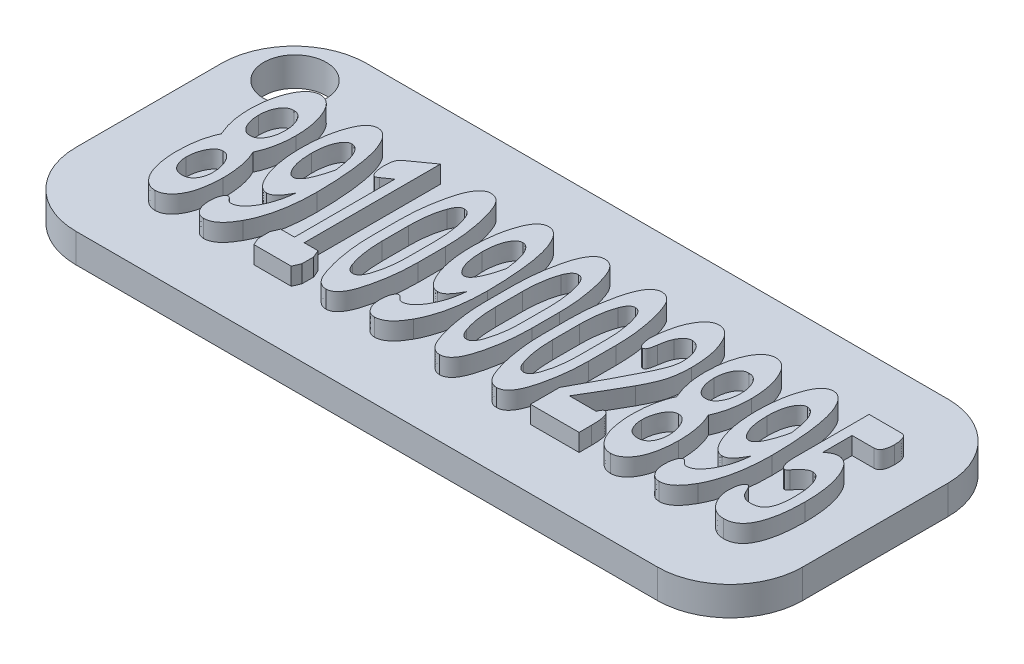
from build123d import *

# Parameters (mm, degrees)
SKETCH_1_W          = 50
SKETCH_1_H          = 20
EXTRUDE_1_DEPTH     = 2
EXTRUDE_447_DEPTH   = 1.2
FILLET_1_R          = 5
FILLET_2_R          = 5
FILLET_3_R          = 5
FILLET_4_R          = 5
SKETCH_4_R          = 2.151855383
CUT_EXTRUDE_1_DEPTH = 3


with BuildPart() as part:
    # Эскиз1 → Бобышка-Вытянуть1 (new body)
    with BuildSketch(Plane(origin=(0, 0, 0), x_dir=(1, 0, 0), z_dir=(0, 1, 0))):
        with Locations((25, 10)):
            Rectangle(SKETCH_1_W, SKETCH_1_H)
    extrude(amount=EXTRUDE_1_DEPTH)

    # Эскиз2 → Extrude 447 (add)
    # profile 1 of 11: a face of its own
    with BuildSketch(Plane(origin=(0, 2, 0), x_dir=(1, 0, 0), z_dir=(0, 1, 0))):
        with BuildLine():
            add(Edge.make_bspline(
                [(7.573556309, 9.600285908), (7.614097975, 9.514557394), (7.696746897, 9.339789807), (7.797801731, 9.062374027), (7.880558655, 8.767248004), (7.951489199, 8.456701902), (8.00595283, 8.129212501), (8.044897616, 7.785319285), (8.06867813, 7.42575086), (8.071567234, 7.180504155), (8.073036116, 7.05581548)],
                knots=[0, 0, 0, 0, 0.869863627, 1.773318598, 2.705048754, 3.681115649, 4.69499462, 5.749702211, 6.855900433, 8, 8, 8, 8], degree=3))
            add(Edge.make_bspline(
                [(8.073036116, 7.05581548), (8.071300059, 6.917145605), (8.067898843, 6.645468945), (8.03317454, 6.246264419), (7.975620786, 5.864714253), (7.898566629, 5.502509161), (7.800399961, 5.166235556), (7.670137386, 4.865473177), (7.520838011, 4.597477557), (7.339918246, 4.372882613), (7.143065075, 4.191376949), (6.932401715, 4.057830032), (6.707417427, 3.977887628), (6.552534727, 3.967409177), (6.47522375, 3.962178772)],
                knots=[0, 0, 0, 0, 1.307194334, 2.561004629, 3.774488178, 4.943198719, 6.050810285, 7.0706307, 8.027859035, 8.934048178, 9.777701725, 10.541735887, 11.272095442, 12, 12, 12, 12], degree=3))
            add(Edge.make_bspline(
                [(6.47522375, 3.962178772), (6.398758529, 3.967377244), (6.245524582, 3.977794821), (6.022692765, 4.058574413), (5.812990911, 4.190715372), (5.618085633, 4.372268194), (5.44331203, 4.599271211), (5.292379621, 4.86580684), (5.163838969, 5.168326766), (5.064629644, 5.505868942), (4.987398844, 5.868910316), (4.934027364, 6.250889169), (4.897970237, 6.648043089), (4.894747173, 6.91800445), (4.89310185, 7.05581548)],
                knots=[0, 0, 0, 0, 0.721796221, 1.446457375, 2.212675403, 3.05265627, 3.951211607, 4.911176021, 5.941488938, 7.052266429, 8.232375546, 9.44812684, 10.697308883, 12, 12, 12, 12], degree=3))
            add(Edge.make_bspline(
                [(4.89310185, 7.05581548), (4.894568323, 7.180504891), (4.897452689, 7.425753043), (4.9212673, 7.78531105), (4.960090766, 8.129241336), (5.014981174, 8.456600333), (5.08446419, 8.767842206), (5.172490412, 9.061301884), (5.268561762, 9.340392082), (5.351724858, 9.514667147), (5.392581656, 9.600285908)],
                knots=[0, 0, 0, 0, 1.144171302, 2.250438881, 3.305212602, 4.319155143, 5.295283236, 6.229301096, 7.130081833, 8, 8, 8, 8], degree=3))
            add(Edge.make_bspline(
                [(5.392581656, 9.600285908), (5.315817568, 9.787048365), (5.160841455, 10.164096025), (5.006931525, 10.766990108), (4.909981225, 11.402377485), (4.898807421, 11.838421115), (4.89310185, 12.061073855)],
                knots=[0, 0, 0, 0, 0.957073933, 1.932200357, 2.944139471, 4, 4, 4, 4], degree=3))
            add(Edge.make_bspline(
                [(4.89310185, 12.061073855), (4.898418341, 12.27754542), (4.908708054, 12.696511582), (4.993522254, 13.301262805), (5.130459125, 13.859724169), (5.292766455, 14.287625184), (5.444959878, 14.59626455), (5.572022432, 14.792435075), (5.701256202, 14.962512673), (5.841669645, 15.100122201), (5.988929324, 15.210766986), (6.147233304, 15.286698295), (6.313045616, 15.333643061), (6.426107165, 15.339862642), (6.483068983, 15.342996144)],
                knots=[0, 0, 0, 0, 1.967284804, 3.807547495, 5.539313067, 7.184775065, 7.957393082, 8.663057112, 9.306676465, 9.895090154, 10.445108397, 10.973224193, 11.482697546, 12, 12, 12, 12], degree=3))
            add(Edge.make_bspline(
                [(6.483068983, 15.342996144), (6.540030622, 15.339862528), (6.653091816, 15.33364272), (6.818906789, 15.286699655), (6.977200186, 15.210761579), (7.124502289, 15.100143922), (7.264739854, 14.962421929), (7.394438864, 14.793194832), (7.518098227, 14.595404626), (7.670991349, 14.28749902), (7.836385865, 13.860286235), (7.972388537, 13.301187823), (8.057492836, 12.696532351), (8.06774106, 12.277552495), (8.073036116, 12.061073855)],
                knots=[0, 0, 0, 0, 0.517362775, 1.026895537, 1.555072916, 2.105155296, 2.693637599, 3.337332004, 4.038837688, 4.811545799, 6.460041003, 8.192008513, 10.032485794, 12, 12, 12, 12], degree=3))
            add(Edge.make_bspline(
                [(8.073036116, 12.061073855), (8.067469393, 11.836644637), (8.056587536, 11.397929314), (7.95824123, 10.760579226), (7.810565083, 10.157347516), (7.651813566, 9.784220506), (7.573556309, 9.600285908)],
                knots=[0, 0, 0, 0, 1.063791813, 2.079505389, 3.053283751, 4, 4, 4, 4], degree=3))
        make_face()
        with BuildLine():
            add(Edge.make_bspline(
                [(7.40357627, 12.000927072), (7.400881187, 12.101399241), (7.3956698, 12.295678693), (7.346723591, 12.574577781), (7.273005759, 12.832078474), (7.163415472, 13.060108044), (7.032907644, 13.254347429), (6.872502773, 13.398604446), (6.686741605, 13.488581823), (6.552877353, 13.497503384), (6.48568406, 13.50198157)],
                knots=[0, 0, 0, 0, 1.239528042, 2.396831194, 3.486589409, 4.536162785, 5.509682768, 6.35620442, 7.174895202, 8, 8, 8, 8], degree=3))
            add(Edge.make_bspline(
                [(6.48568406, 13.50198157), (6.41756145, 13.497655353), (6.282708964, 13.489091368), (6.096066845, 13.397823779), (5.933161756, 13.255405207), (5.802856554, 13.059951899), (5.693093666, 12.832123363), (5.619425513, 12.574564807), (5.570465074, 12.295682293), (5.565255725, 12.101400468), (5.562561695, 12.000927072)],
                knots=[0, 0, 0, 0, 0.833820688, 1.650594315, 2.50321944, 3.474459699, 4.521575254, 5.608781546, 6.763374602, 8, 8, 8, 8], degree=3))
            add(Edge.make_bspline(
                [(5.562561695, 12.000927072), (5.565266502, 11.89959127), (5.570497938, 11.703595072), (5.619342719, 11.422020541), (5.693413454, 11.162223891), (5.80108844, 10.931934152), (5.93514389, 10.738900345), (6.094340772, 10.592500066), (6.283734232, 10.506365477), (6.417745012, 10.495115588), (6.48568406, 10.489412265)],
                knots=[0, 0, 0, 0, 1.241668429, 2.401543046, 3.494043673, 4.546047416, 5.504137523, 6.359918461, 7.168532727, 8, 8, 8, 8], degree=3))
            add(Edge.make_bspline(
                [(6.48568406, 10.489412265), (6.552695802, 10.495261034), (6.685717473, 10.506871134), (6.874233464, 10.591733044), (7.030924822, 10.739942893), (7.165187614, 10.931776637), (7.272684512, 11.162269517), (7.346806805, 11.422007357), (7.395636821, 11.703598728), (7.400870371, 11.899592516), (7.40357627, 12.000927072)],
                knots=[0, 0, 0, 0, 0.822795555, 1.633290479, 2.483061068, 3.443379481, 4.497829953, 5.592871494, 6.755443724, 8, 8, 8, 8], degree=3))
        make_face(mode=Mode.SUBTRACT)
        with BuildLine():
            add(Edge.make_bspline(
                [(7.40357627, 7.032279782), (7.40083224, 7.132728778), (7.395428238, 7.330549733), (7.344625757, 7.619766765), (7.260193419, 7.893490889), (7.148083999, 8.145792408), (7.013914707, 8.362633192), (6.856156217, 8.525506054), (6.676981716, 8.630098946), (6.547067499, 8.642358414), (6.483068983, 8.64839769)],
                knots=[0, 0, 0, 0, 1.189489759, 2.34254209, 3.466495789, 4.576118851, 5.607605723, 6.469471387, 7.246028937, 8, 8, 8, 8], degree=3))
            add(Edge.make_bspline(
                [(6.483068983, 8.64839769), (6.419071355, 8.642357997), (6.289158942, 8.630097682), (6.109970089, 8.525511526), (5.952276444, 8.362608226), (5.817382195, 8.145228937), (5.706032156, 7.890764764), (5.62148475, 7.614512598), (5.570417776, 7.320959943), (5.565221953, 7.119656519), (5.562561695, 7.016589317)],
                knots=[0, 0, 0, 0, 0.748318014, 1.519053169, 2.374456823, 3.398209916, 4.508873786, 5.634203001, 6.788713712, 8, 8, 8, 8], degree=3))
            add(Edge.make_bspline(
                [(5.562561695, 7.016589317), (5.564519013, 6.937906225), (5.568358614, 6.783556341), (5.614649943, 6.561063276), (5.686188734, 6.353459053), (5.781401031, 6.163023537), (5.912177847, 6.003496362), (6.075347034, 5.885390745), (6.270349502, 5.815595323), (6.410142975, 5.807445081), (6.483068983, 5.803193347)],
                knots=[0, 0, 0, 0, 1.103259055, 2.164224919, 3.174489227, 4.181783474, 5.137723691, 6.0412155, 6.978161634, 8, 8, 8, 8], degree=3))
            add(Edge.make_bspline(
                [(6.483068983, 5.803193347), (6.556895147, 5.807344341), (6.697617482, 5.81525668), (6.893245968, 5.885521907), (7.056713141, 6.002687874), (7.184294754, 6.164041181), (7.28132663, 6.35464223), (7.350843043, 6.565721818), (7.39824932, 6.79308981), (7.401765162, 6.950957658), (7.40357627, 7.032279782)],
                knots=[0, 0, 0, 0, 1.024249911, 1.952354446, 2.84732035, 3.786524278, 4.784313077, 5.807988776, 6.870833993, 8, 8, 8, 8], degree=3))
        make_face(mode=Mode.SUBTRACT)
    # profile 2 of 11: a face of its own
    with BuildSketch(Plane(origin=(0, 2, 0), x_dir=(1, 0, 0), z_dir=(0, 1, 0))):
        with BuildLine():
            add(Edge.make_bspline(
                [(11.487281327, 8.64839769), (11.443120138, 8.563194295), (11.360211839, 8.403233281), (11.227347166, 8.189670085), (11.101271099, 8.014308364), (10.981695952, 7.875258561), (10.860868515, 7.771543805), (10.73789485, 7.699387944), (10.611308828, 7.650740653), (10.523600736, 7.646361206), (10.480476482, 7.644207922)],
                knots=[0, 0, 0, 0, 1.544491333, 2.899630935, 4.044871523, 5.019150062, 5.845686048, 6.594201469, 7.308797954, 8, 8, 8, 8], degree=3))
            add(Edge.make_bspline(
                [(10.480476482, 7.644207922), (10.430290606, 7.647817631), (10.329782088, 7.655046887), (10.183984439, 7.712466058), (10.043153577, 7.800943198), (9.907418997, 7.92533019), (9.779803639, 8.086066605), (9.65342786, 8.277990517), (9.534963838, 8.506651707), (9.42092589, 8.765889021), (9.31824374, 9.051066319), (9.226522564, 9.355676466), (9.147531027, 9.677551496), (9.086438701, 10.01754375), (9.035758997, 10.373307064), (9.003124173, 10.746078019), (8.981616037, 11.135084147), (8.978430245, 11.400300708), (8.976806907, 11.535443274)],
                knots=[0, 0, 0, 0, 0.540116355, 1.081704643, 1.668900416, 2.328128021, 3.056702268, 3.878395356, 4.803970782, 5.831493441, 6.932328587, 8.071895476, 9.262630745, 10.505951035, 11.797462611, 13.138567462, 14.541941224, 16, 16, 16, 16], degree=3))
            add(Edge.make_bspline(
                [(8.976806907, 11.535443274), (8.979878585, 11.746549179), (8.985894355, 12.159992454), (9.045914146, 12.764320197), (9.136496445, 13.340136315), (9.231105871, 13.708310595), (9.277540822, 13.889013043)],
                knots=[0, 0, 0, 0, 1.064168464, 2.084135415, 3.059680597, 4, 4, 4, 4], degree=3))
            add(Edge.make_bspline(
                [(9.277540822, 13.889013043), (9.312722205, 14.002800007), (9.379225867, 14.217892454), (9.495353429, 14.516034372), (9.625556706, 14.767410328), (9.763771865, 14.976387376), (9.915484797, 15.139702578), (10.080541985, 15.254844306), (10.256576245, 15.329464525), (10.3795264, 15.338473449), (10.441250319, 15.342996144)],
                knots=[0, 0, 0, 0, 1.436180298, 2.714823602, 3.852703128, 4.844061658, 5.728925662, 6.522115595, 7.258066685, 8, 8, 8, 8], degree=3))
            add(Edge.make_bspline(
                [(10.441250319, 15.342996144), (10.48499613, 15.339980522), (10.572875844, 15.333922523), (10.703346169, 15.300039727), (10.826729708, 15.236568608), (10.949335325, 15.155760012), (11.063874085, 15.046298247), (11.173728678, 14.913745616), (11.28098276, 14.759182636), (11.382705398, 14.580405977), (11.477619014, 14.379480761), (11.571081288, 14.158754904), (11.651873381, 13.915640274), (11.733225342, 13.653416946), (11.797527188, 13.367406965), (11.864523737, 13.062959851), (11.921962435, 12.736666198), (11.986351341, 12.271998383), (12.057994352, 11.670208848), (12.112579501, 10.931994349), (12.152408758, 10.178655307), (12.155287663, 9.670948051), (12.156741173, 9.414615404)],
                knots=[0, 0, 0, 0, 0.402210474, 0.807989175, 1.226820742, 1.670824282, 2.152214144, 2.674888608, 3.249973138, 3.877429647, 4.56122259, 5.289612762, 6.07684574, 6.9125179, 7.809462526, 8.76710454, 9.775136441, 10.85051479, 13.074497134, 15.338564747, 17.646521651, 20, 20, 20, 20], degree=3))
            add(Edge.make_bspline(
                [(12.156741173, 9.414615404), (12.154611607, 9.200102556), (12.15046068, 8.781976483), (12.107252636, 8.171989025), (12.0400466, 7.594116992), (11.946568186, 7.048348086), (11.828035131, 6.533913539), (11.677341373, 6.054064828), (11.505265073, 5.603486626), (11.361652133, 5.323489564), (11.291150513, 5.186035052)],
                knots=[0, 0, 0, 0, 1.180832844, 2.301666342, 3.364825312, 4.382616933, 5.348807173, 6.268666431, 7.150063902, 8, 8, 8, 8], degree=3))
            add(Edge.make_bspline(
                [(11.291150513, 5.186035052), (11.235884251, 5.089309312), (11.130582541, 4.905012684), (10.958139223, 4.654318466), (10.779370561, 4.444113433), (10.599607472, 4.268136364), (10.411664053, 4.132527393), (10.219965318, 4.034140776), (10.023105765, 3.972455853), (9.889884021, 3.965576274), (9.824092024, 3.962178772)],
                knots=[0, 0, 0, 0, 1.334909709, 2.54347351, 3.640443885, 4.638032018, 5.551364312, 6.406426828, 7.213008643, 8, 8, 8, 8], degree=3))
            add(Edge.make_bspline(
                [(9.824092024, 3.962178772), (9.753406595, 3.967465112), (9.615349029, 3.977790002), (9.423069807, 4.06783393), (9.260135852, 4.216415572), (9.18270215, 4.345824267), (9.141556791, 4.414587183)],
                knots=[0, 0, 0, 0, 0.978915843, 1.911946217, 2.890486694, 4, 4, 4, 4], degree=3))
            add(Edge.make_bspline(
                [(9.141556791, 4.414587183), (9.115145115, 4.467877985), (9.060198525, 4.578743643), (9.014743898, 4.768366881), (8.981635621, 4.978252173), (8.978467391, 5.12659397), (8.976806907, 5.204340595)],
                knots=[0, 0, 0, 0, 0.873536651, 1.817297042, 2.856035239, 4, 4, 4, 4], degree=3))
            add(Edge.make_bspline(
                [(8.976806907, 5.204340595), (8.978729981, 5.267999654), (8.982426179, 5.390353994), (8.998760292, 5.565793479), (9.033354377, 5.724389396), (9.079353503, 5.863724378), (9.133354691, 5.981932664), (9.199664895, 6.06619865), (9.269097869, 6.12918679), (9.324484335, 6.135111997), (9.350762992, 6.13792327)],
                knots=[0, 0, 0, 0, 1.419175441, 2.727691474, 3.920195547, 5.025849715, 5.998814525, 6.787596777, 7.424763283, 8, 8, 8, 8], degree=3))
            add(Edge.make_bspline(
                [(9.350762992, 6.13792327), (9.382773052, 6.127965343), (9.463422998, 6.102876158), (9.515491409, 6.035018737), (9.546893807, 5.994094006)],
                knots=[0, 0, 0, 0, 0.793802374, 2, 2, 2, 2], degree=3))
            add(Edge.make_bspline(
                [(9.546893807, 5.994094006), (9.570445248, 5.965433361), (9.614066841, 5.912348585), (9.687655126, 5.848914152), (9.76703836, 5.812349348), (9.821161039, 5.806200307), (9.847627721, 5.803193347)],
                knots=[0, 0, 0, 0, 1.206683572, 2.234999471, 3.136892176, 4, 4, 4, 4], degree=3))
            add(Edge.make_bspline(
                [(9.847627721, 5.803193347), (9.895024222, 5.805572391), (9.989720428, 5.810325621), (10.128519102, 5.853825328), (10.266772506, 5.915780341), (10.398905962, 6.009581437), (10.529753296, 6.126311855), (10.652963112, 6.272450751), (10.780009499, 6.439005536), (10.940586919, 6.702591136), (11.122986817, 7.069602289), (11.295376695, 7.554890094), (11.421772, 8.085457175), (11.464993829, 8.456874799), (11.487281327, 8.64839769)],
                knots=[0, 0, 0, 0, 0.484168293, 0.967347815, 1.478659544, 2.030891222, 2.618845486, 3.27058146, 3.984812665, 4.762718328, 6.427668094, 8.172882214, 10.026532363, 12, 12, 12, 12], degree=3))
        make_face()
        with BuildLine():
            add(Edge.make_bspline(
                [(11.487281327, 11.404689398), (11.47548573, 11.496273531), (11.452760452, 11.672718592), (11.41340804, 11.926438075), (11.372022499, 12.160375645), (11.326387468, 12.37366511), (11.272439781, 12.565796569), (11.220164612, 12.73811608), (11.158413363, 12.888401877), (11.079735552, 13.055990953), (10.970393897, 13.225893267), (10.8255493, 13.381089174), (10.666311975, 13.485428052), (10.549776703, 13.496594222), (10.493551869, 13.50198157)],
                knots=[0, 0, 0, 0, 1.341561386, 2.584638553, 3.72986605, 4.793097259, 5.751690096, 6.62885173, 7.407292807, 8.109698356, 9.318098846, 10.321251498, 11.190053334, 12, 12, 12, 12], degree=3))
            add(Edge.make_bspline(
                [(10.493551869, 13.50198157), (10.435451232, 13.494972666), (10.31510073, 13.480454321), (10.150726883, 13.367165454), (10.007173173, 13.192292277), (9.880718397, 12.957059594), (9.774400208, 12.669553324), (9.701609912, 12.334202888), (9.653881713, 11.956967505), (9.648886848, 11.690769847), (9.646266752, 11.551133739)],
                knots=[0, 0, 0, 0, 0.604297075, 1.251749713, 2.021041256, 2.959625801, 4.029815661, 5.217391592, 6.540360535, 8, 8, 8, 8], degree=3))
            add(Edge.make_bspline(
                [(9.646266752, 11.551133739), (9.648909721, 11.404532897), (9.653959121, 11.124451504), (9.701587485, 10.727252939), (9.774512787, 10.371772355), (9.882102547, 10.06705024), (10.009809031, 9.81850141), (10.146841716, 9.634937696), (10.297793082, 9.510461458), (10.411680806, 9.493248707), (10.464786016, 9.485222497)],
                knots=[0, 0, 0, 0, 1.482531622, 2.83238157, 4.041481393, 5.146072842, 6.092829469, 6.853155664, 7.465232874, 8, 8, 8, 8], degree=3))
            add(Edge.make_bspline(
                [(10.464786016, 9.485222497), (10.5123559, 9.491123235), (10.615011535, 9.503857005), (10.753207026, 9.6101873), (10.88780989, 9.763359278), (11.015431521, 9.978643306), (11.139812025, 10.250918549), (11.2610164, 10.581959775), (11.381437375, 10.971900123), (11.45050874, 11.254328597), (11.487281327, 11.404689398)],
                knots=[0, 0, 0, 0, 0.497696831, 1.074027963, 1.777276761, 2.652500584, 3.697328195, 4.93381738, 6.367609082, 8, 8, 8, 8], degree=3))
        make_face(mode=Mode.SUBTRACT)
    # profile 3 of 11: a face of its own
    with BuildSketch(Plane(origin=(0, 2, 0), x_dir=(1, 0, 0), z_dir=(0, 1, 0))):
        with BuildLine():
            Line((14.734161578, 15.342996144), (14.734161578, 5.970558308))
            Line((14.734161578, 5.970558308), (15.403621423, 5.970558308))
            Line((15.403621423, 5.970558308), (15.683434718, 5.970558308))
            Line((15.683434718, 5.970558308), (15.905716307, 5.455388037))
            Line((15.905716307, 5.455388037), (15.905716307, 5.050051021))
            Line((15.905716307, 5.050051021), (15.905716307, 4.644714005))
            Line((15.905716307, 4.644714005), (15.683434718, 4.129543734))
            Line((15.683434718, 4.129543734), (15.403621423, 4.129543734))
            Line((15.403621423, 4.129543734), (13.395241887, 4.129543734))
            Line((13.395241887, 4.129543734), (13.115428592, 4.129543734))
            Line((13.115428592, 4.129543734), (12.893147003, 4.644714005))
            Line((12.893147003, 4.644714005), (12.893147003, 5.050051021))
            Line((12.893147003, 5.050051021), (12.893147003, 5.455388037))
            Line((12.893147003, 5.455388037), (13.115428592, 5.970558308))
            Line((13.115428592, 5.970558308), (13.395241887, 5.970558308))
            Line((13.395241887, 5.970558308), (14.064701732, 5.970558308))
            Line((14.064701732, 5.970558308), (14.064701732, 12.882208197))
            Line((14.064701732, 12.882208197), (13.442313282, 12.440260096))
            add(Edge.make_bspline(
                [(13.442313282, 12.440260096), (13.400372507, 12.40965096), (13.332276525, 12.35995328), (13.251180232, 12.338620585), (13.220031693, 12.33042684)],
                knots=[0, 0, 0, 0, 1.231813479, 2, 2, 2, 2], degree=3))
            add(Edge.make_bspline(
                [(13.220031693, 12.33042684), (13.197191569, 12.33445352), (13.148194041, 12.343091711), (13.088553776, 12.40749367), (13.031345844, 12.496313715), (12.98569728, 12.622229882), (12.944890165, 12.770756455), (12.913520481, 12.938682951), (12.8953038, 13.122381825), (12.893884287, 13.250017861), (12.893147003, 13.316311066)],
                knots=[0, 0, 0, 0, 0.495128156, 1.062168302, 1.834510207, 2.819056819, 3.966528459, 5.208382639, 6.55005478, 8, 8, 8, 8], degree=3))
            add(Edge.make_bspline(
                [(12.893147003, 13.316311066), (12.894227196, 13.375617271), (12.896279217, 13.488279978), (12.909340159, 13.647193476), (12.928629109, 13.786731687), (12.960341254, 13.908158067), (13.005598347, 14.017923911), (13.072252572, 14.117153701), (13.1573881, 14.21007096), (13.224469484, 14.263846838), (13.259257856, 14.291734981)],
                knots=[0, 0, 0, 0, 1.305535163, 2.480096727, 3.50872797, 4.402489535, 5.236569861, 6.109485237, 7.019580023, 8, 8, 8, 8], degree=3))
            Line((13.259257856, 14.291734981), (14.734161578, 15.342996144))
        make_face()
    # profile 4 of 11: a face of its own
    with BuildSketch(Plane(origin=(0, 2, 0), x_dir=(1, 0, 0), z_dir=(0, 1, 0))):
        with BuildLine():
            Line((19.822056403, 10.596630443), (19.822056403, 8.708544473))
            add(Edge.make_bspline(
                [(19.822056403, 8.708544473), (19.816904474, 8.432046079), (19.806694901, 7.884109393), (19.728905569, 7.070741409), (19.601642054, 6.274674293), (19.451951183, 5.63174011), (19.313920316, 5.148200517), (19.193082113, 4.835397678), (19.06453519, 4.569216662), (18.923019986, 4.351387393), (18.770942105, 4.178403035), (18.603583293, 4.055362338), (18.423626723, 3.975058565), (18.297372791, 3.966451197), (18.234704347, 3.962178772)],
                knots=[0, 0, 0, 0, 1.872673122, 3.711075104, 5.529225634, 7.329580626, 8.179610133, 8.932920447, 9.598355524, 10.178084822, 10.688068346, 11.148661017, 11.577422355, 12, 12, 12, 12], degree=3))
            add(Edge.make_bspline(
                [(18.234704347, 3.962178772), (18.163098049, 3.967442375), (18.020515124, 3.977923294), (17.820093188, 4.072884992), (17.637367438, 4.219142558), (17.507076275, 4.38689956), (17.407594793, 4.550345663), (17.336287846, 4.703103417), (17.263184898, 4.8785026), (17.189774986, 5.077118893), (17.120233422, 5.300186804), (17.049784906, 5.546112318), (16.978525016, 5.816051721), (16.888149788, 6.211811939), (16.790591085, 6.731524411), (16.702797356, 7.374529202), (16.653931287, 8.035706193), (16.646085967, 8.482701241), (16.642122137, 8.708544473)],
                knots=[0, 0, 0, 0, 0.642640119, 1.279629165, 1.962282587, 2.739474992, 3.180359586, 3.686689951, 4.257568184, 4.894314614, 5.595458888, 6.364336271, 7.20144684, 8.113027288, 10.024980623, 11.968482452, 13.963084925, 16, 16, 16, 16], degree=3))
            Line((16.642122137, 8.708544473), (16.642122137, 10.596630443))
            add(Edge.make_bspline(
                [(16.642122137, 10.596630443), (16.647338081, 10.872247431), (16.657690701, 11.419292825), (16.734721099, 12.231062213), (16.863933224, 13.025621842), (17.008956643, 13.668610802), (17.148378288, 14.152323265), (17.267667611, 14.466661007), (17.397983894, 14.733575723), (17.537583905, 14.953623625), (17.690580889, 15.125714473), (17.855665239, 15.250569948), (18.035405995, 15.33000468), (18.161603568, 15.338686677), (18.224244037, 15.342996144)],
                knots=[0, 0, 0, 0, 1.867917534, 3.707448116, 5.520882168, 7.321014604, 8.171565946, 8.930852488, 9.596696077, 10.181724631, 10.692021235, 11.148138377, 11.577162933, 12, 12, 12, 12], degree=3))
            add(Edge.make_bspline(
                [(18.224244037, 15.342996144), (18.295746132, 15.337496131), (18.437769836, 15.326571524), (18.639489124, 15.235531296), (18.820614653, 15.089256697), (18.950019221, 14.92253741), (19.048035427, 14.760581854), (19.120812757, 14.609421336), (19.192614477, 14.435164619), (19.266488855, 14.237379138), (19.339961835, 14.015236274), (19.408397177, 13.767554168), (19.480637049, 13.497027445), (19.570413226, 13.100952784), (19.671369331, 12.580785778), (19.761829259, 11.936910266), (19.810250111, 11.272945392), (19.818083533, 10.824213436), (19.822056403, 10.596630443)],
                knots=[0, 0, 0, 0, 0.642344401, 1.275880528, 1.958219819, 2.724006707, 3.164688423, 3.663720908, 4.234336445, 4.863422188, 5.566662655, 6.342741925, 7.179467287, 8.090628261, 10.003171379, 11.954627198, 13.948311832, 16, 16, 16, 16], degree=3))
        make_face()
        with BuildLine():
            add(Edge.make_bspline(
                [(19.152596557, 10.567864591), (19.149452051, 10.786899025), (19.143347024, 11.21215213), (19.071347173, 11.827950094), (18.968737394, 12.404280746), (18.853119647, 12.764651455), (18.796946015, 12.939739902)],
                knots=[0, 0, 0, 0, 1.090347458, 2.116898395, 3.085082863, 4, 4, 4, 4], degree=3))
            add(Edge.make_bspline(
                [(18.796946015, 12.939739902), (18.764271985, 13.023863674), (18.704875713, 13.176787521), (18.569094972, 13.357869641), (18.411050807, 13.483026909), (18.288892639, 13.495778918), (18.229474192, 13.50198157)],
                knots=[0, 0, 0, 0, 1.26538402, 2.300270066, 3.173241431, 4, 4, 4, 4], degree=3))
            add(Edge.make_bspline(
                [(18.229474192, 13.50198157), (18.200441655, 13.499864576), (18.142680317, 13.495652737), (18.059205196, 13.464342385), (17.978907912, 13.416288135), (17.903751318, 13.347044327), (17.83196916, 13.259296728), (17.768317154, 13.150454413), (17.704645893, 13.025296375), (17.669816229, 12.933163083), (17.65154206, 12.884823275)],
                knots=[0, 0, 0, 0, 0.773889233, 1.539682063, 2.354176973, 3.26093301, 4.253579485, 5.371542193, 6.620920351, 8, 8, 8, 8], degree=3))
            add(Edge.make_bspline(
                [(17.65154206, 12.884823275), (17.598097171, 12.72017243), (17.487055603, 12.378080081), (17.389224663, 11.821760087), (17.321222641, 11.21376433), (17.314877064, 10.788626753), (17.311581982, 10.567864591)],
                knots=[0, 0, 0, 0, 0.882012772, 1.832543419, 2.87449986, 4, 4, 4, 4], degree=3))
            Line((17.311581982, 10.567864591), (17.311581982, 8.737310326))
            add(Edge.make_bspline(
                [(17.311581982, 8.737310326), (17.31627713, 8.517469453), (17.325391106, 8.090725823), (17.390416227, 7.473127309), (17.499058516, 6.898580876), (17.614021161, 6.539706316), (17.669847603, 6.365435014)],
                knots=[0, 0, 0, 0, 1.09463067, 2.124839939, 3.089412786, 4, 4, 4, 4], degree=3))
            add(Edge.make_bspline(
                [(17.669847603, 6.365435014), (17.702803103, 6.28155244), (17.762518381, 6.12955744), (17.895106153, 5.945541569), (18.05544043, 5.82278276), (18.178038184, 5.809578277), (18.237319425, 5.803193347)],
                knots=[0, 0, 0, 0, 1.264540884, 2.291344674, 3.173792307, 4, 4, 4, 4], degree=3))
            add(Edge.make_bspline(
                [(18.237319425, 5.803193347), (18.266360037, 5.805301413), (18.324137438, 5.809495491), (18.407490521, 5.840940778), (18.487739272, 5.888102432), (18.560371322, 5.959142134), (18.632357475, 6.045715331), (18.695814625, 6.154771925), (18.759546358, 6.279863464), (18.794367029, 6.372006645), (18.81263648, 6.420351642)],
                knots=[0, 0, 0, 0, 0.775556524, 1.542999202, 2.359248885, 3.250723015, 4.245508079, 5.365879361, 6.617949219, 8, 8, 8, 8], degree=3))
            add(Edge.make_bspline(
                [(18.81263648, 6.420351642), (18.865812661, 6.585049981), (18.976609828, 6.928213197), (19.078833417, 7.483838031), (19.14190737, 8.092501584), (19.148937667, 8.516593437), (19.152596557, 8.737310326)],
                knots=[0, 0, 0, 0, 0.881942544, 1.837603474, 2.874589474, 4, 4, 4, 4], degree=3))
            Line((19.152596557, 8.737310326), (19.152596557, 10.567864591))
        make_face(mode=Mode.SUBTRACT)
    # profile 5 of 11: a face of its own
    with BuildSketch(Plane(origin=(0, 2, 0), x_dir=(1, 0, 0), z_dir=(0, 1, 0))):
        with BuildLine():
            add(Edge.make_bspline(
                [(23.236301615, 8.64839769), (23.192140426, 8.563194295), (23.109232127, 8.403233281), (22.976367454, 8.189670085), (22.850291386, 8.014308364), (22.73071624, 7.875258561), (22.609888802, 7.771543805), (22.486915137, 7.699387944), (22.360329115, 7.650740653), (22.272621023, 7.646361206), (22.229496769, 7.644207922)],
                knots=[0, 0, 0, 0, 1.544491333, 2.899630935, 4.044871523, 5.019150062, 5.845686048, 6.594201469, 7.308797954, 8, 8, 8, 8], degree=3))
            add(Edge.make_bspline(
                [(22.229496769, 7.644207922), (22.179310893, 7.647817631), (22.078802375, 7.655046887), (21.933004726, 7.712466058), (21.792173864, 7.800943198), (21.656439285, 7.92533019), (21.528823926, 8.086066605), (21.402448148, 8.277990517), (21.283984125, 8.506651707), (21.169946177, 8.765889021), (21.067264027, 9.051066319), (20.975542851, 9.355676466), (20.896551314, 9.677551496), (20.835458988, 10.01754375), (20.784779284, 10.373307064), (20.75214446, 10.746078019), (20.730636324, 11.135084147), (20.727450532, 11.400300708), (20.725827194, 11.535443274)],
                knots=[0, 0, 0, 0, 0.540116355, 1.081704643, 1.668900416, 2.328128021, 3.056702268, 3.878395356, 4.803970782, 5.831493441, 6.932328587, 8.071895476, 9.262630745, 10.505951035, 11.797462611, 13.138567462, 14.541941224, 16, 16, 16, 16], degree=3))
            add(Edge.make_bspline(
                [(20.725827194, 11.535443274), (20.728898872, 11.746549179), (20.734914643, 12.159992454), (20.794934433, 12.764320197), (20.885516733, 13.340136315), (20.980126158, 13.708310595), (21.026561109, 13.889013043)],
                knots=[0, 0, 0, 0, 1.064168464, 2.084135415, 3.059680597, 4, 4, 4, 4], degree=3))
            add(Edge.make_bspline(
                [(21.026561109, 13.889013043), (21.061742492, 14.002800007), (21.128246154, 14.217892454), (21.244373716, 14.516034372), (21.374576993, 14.767410328), (21.512792153, 14.976387376), (21.664505084, 15.139702578), (21.829562272, 15.254844306), (22.005596532, 15.329464525), (22.128546688, 15.338473449), (22.190270606, 15.342996144)],
                knots=[0, 0, 0, 0, 1.436180298, 2.714823602, 3.852703128, 4.844061658, 5.728925662, 6.522115595, 7.258066685, 8, 8, 8, 8], degree=3))
            add(Edge.make_bspline(
                [(22.190270606, 15.342996144), (22.234016417, 15.339980522), (22.321896131, 15.333922523), (22.452366457, 15.300039727), (22.575749995, 15.236568608), (22.698355612, 15.155760012), (22.812894372, 15.046298247), (22.922748966, 14.913745616), (23.030003047, 14.759182636), (23.131725685, 14.580405977), (23.226639301, 14.379480761), (23.320101575, 14.158754904), (23.400893668, 13.915640274), (23.482245629, 13.653416946), (23.546547475, 13.367406965), (23.613544024, 13.062959851), (23.670982722, 12.736666198), (23.735371628, 12.271998383), (23.80701464, 11.670208848), (23.861599788, 10.931994349), (23.901429045, 10.178655307), (23.90430795, 9.670948051), (23.90576146, 9.414615404)],
                knots=[0, 0, 0, 0, 0.402210474, 0.807989175, 1.226820742, 1.670824282, 2.152214144, 2.674888608, 3.249973138, 3.877429647, 4.56122259, 5.289612762, 6.07684574, 6.9125179, 7.809462526, 8.76710454, 9.775136441, 10.85051479, 13.074497134, 15.338564747, 17.646521651, 20, 20, 20, 20], degree=3))
            add(Edge.make_bspline(
                [(23.90576146, 9.414615404), (23.903631894, 9.200102556), (23.899480968, 8.781976483), (23.856272923, 8.171989025), (23.789066887, 7.594116992), (23.695588473, 7.048348086), (23.577055418, 6.533913539), (23.42636166, 6.054064828), (23.254285361, 5.603486626), (23.110672421, 5.323489564), (23.0401708, 5.186035052)],
                knots=[0, 0, 0, 0, 1.180832844, 2.301666342, 3.364825312, 4.382616933, 5.348807173, 6.268666431, 7.150063902, 8, 8, 8, 8], degree=3))
            add(Edge.make_bspline(
                [(23.0401708, 5.186035052), (22.984904538, 5.089309312), (22.879602828, 4.905012684), (22.70715951, 4.654318466), (22.528390849, 4.444113433), (22.348627759, 4.268136364), (22.16068434, 4.132527393), (21.968985605, 4.034140776), (21.772126052, 3.972455853), (21.638904308, 3.965576274), (21.573112311, 3.962178772)],
                knots=[0, 0, 0, 0, 1.334909709, 2.54347351, 3.640443885, 4.638032018, 5.551364312, 6.406426828, 7.213008643, 8, 8, 8, 8], degree=3))
            add(Edge.make_bspline(
                [(21.573112311, 3.962178772), (21.502426882, 3.967465112), (21.364369316, 3.977790002), (21.172090094, 4.06783393), (21.00915614, 4.216415572), (20.931722437, 4.345824267), (20.890577078, 4.414587183)],
                knots=[0, 0, 0, 0, 0.978915843, 1.911946217, 2.890486694, 4, 4, 4, 4], degree=3))
            add(Edge.make_bspline(
                [(20.890577078, 4.414587183), (20.864165402, 4.467877985), (20.809218813, 4.578743643), (20.763764186, 4.768366881), (20.730655908, 4.978252173), (20.727487678, 5.12659397), (20.725827194, 5.204340595)],
                knots=[0, 0, 0, 0, 0.873536651, 1.817297042, 2.856035239, 4, 4, 4, 4], degree=3))
            add(Edge.make_bspline(
                [(20.725827194, 5.204340595), (20.727750268, 5.267999654), (20.731446466, 5.390353994), (20.747780579, 5.565793479), (20.782374664, 5.724389396), (20.82837379, 5.863724378), (20.882374978, 5.981932664), (20.948685183, 6.06619865), (21.018118156, 6.12918679), (21.073504622, 6.135111997), (21.09978328, 6.13792327)],
                knots=[0, 0, 0, 0, 1.419175441, 2.727691474, 3.920195547, 5.025849715, 5.998814525, 6.787596777, 7.424763283, 8, 8, 8, 8], degree=3))
            add(Edge.make_bspline(
                [(21.09978328, 6.13792327), (21.131793339, 6.127965343), (21.212443285, 6.102876158), (21.264511697, 6.035018737), (21.295914094, 5.994094006)],
                knots=[0, 0, 0, 0, 0.793802374, 2, 2, 2, 2], degree=3))
            add(Edge.make_bspline(
                [(21.295914094, 5.994094006), (21.319465535, 5.965433361), (21.363087128, 5.912348585), (21.436675413, 5.848914152), (21.516058647, 5.812349348), (21.570181327, 5.806200307), (21.596648009, 5.803193347)],
                knots=[0, 0, 0, 0, 1.206683572, 2.234999471, 3.136892176, 4, 4, 4, 4], degree=3))
            add(Edge.make_bspline(
                [(21.596648009, 5.803193347), (21.644044509, 5.805572391), (21.738740716, 5.810325621), (21.877539389, 5.853825328), (22.015792793, 5.915780341), (22.147926249, 6.009581437), (22.278773583, 6.126311855), (22.401983399, 6.272450751), (22.529029786, 6.439005536), (22.689607206, 6.702591136), (22.872007104, 7.069602289), (23.044396982, 7.554890094), (23.170792288, 8.085457175), (23.214014116, 8.456874799), (23.236301615, 8.64839769)],
                knots=[0, 0, 0, 0, 0.484168293, 0.967347815, 1.478659544, 2.030891222, 2.618845486, 3.27058146, 3.984812665, 4.762718328, 6.427668094, 8.172882214, 10.026532363, 12, 12, 12, 12], degree=3))
        make_face()
        with BuildLine():
            add(Edge.make_bspline(
                [(23.236301615, 11.404689398), (23.224506017, 11.496273531), (23.201780739, 11.672718592), (23.162428328, 11.926438075), (23.121042786, 12.160375645), (23.075407755, 12.37366511), (23.021460068, 12.565796569), (22.969184899, 12.73811608), (22.907433651, 12.888401877), (22.82875584, 13.055990953), (22.719414185, 13.225893267), (22.574569587, 13.381089174), (22.415332262, 13.485428052), (22.29879699, 13.496594222), (22.242572156, 13.50198157)],
                knots=[0, 0, 0, 0, 1.341561386, 2.584638553, 3.72986605, 4.793097259, 5.751690096, 6.62885173, 7.407292807, 8.109698356, 9.318098846, 10.321251498, 11.190053334, 12, 12, 12, 12], degree=3))
            add(Edge.make_bspline(
                [(22.242572156, 13.50198157), (22.184471519, 13.494972666), (22.064121018, 13.480454321), (21.899747171, 13.367165454), (21.75619346, 13.192292277), (21.629738684, 12.957059594), (21.523420496, 12.669553324), (21.4506302, 12.334202888), (21.402902, 11.956967505), (21.397907136, 11.690769847), (21.39528704, 11.551133739)],
                knots=[0, 0, 0, 0, 0.604297075, 1.251749713, 2.021041256, 2.959625801, 4.029815661, 5.217391592, 6.540360535, 8, 8, 8, 8], degree=3))
            add(Edge.make_bspline(
                [(21.39528704, 11.551133739), (21.397930008, 11.404532897), (21.402979408, 11.124451504), (21.450607772, 10.727252939), (21.523533075, 10.371772355), (21.631122834, 10.06705024), (21.758829318, 9.81850141), (21.895862004, 9.634937696), (22.04681337, 9.510461458), (22.160701093, 9.493248707), (22.213806304, 9.485222497)],
                knots=[0, 0, 0, 0, 1.482531622, 2.83238157, 4.041481393, 5.146072842, 6.092829469, 6.853155664, 7.465232874, 8, 8, 8, 8], degree=3))
            add(Edge.make_bspline(
                [(22.213806304, 9.485222497), (22.261376187, 9.491123235), (22.364031823, 9.503857005), (22.502227314, 9.6101873), (22.636830178, 9.763359278), (22.764451808, 9.978643306), (22.888832312, 10.250918549), (23.010036687, 10.581959775), (23.130457662, 10.971900123), (23.199529027, 11.254328597), (23.236301615, 11.404689398)],
                knots=[0, 0, 0, 0, 0.497696831, 1.074027963, 1.777276761, 2.652500584, 3.697328195, 4.93381738, 6.367609082, 8, 8, 8, 8], degree=3))
        make_face(mode=Mode.SUBTRACT)
    # profile 6 of 11: a face of its own
    with BuildSketch(Plane(origin=(0, 2, 0), x_dir=(1, 0, 0), z_dir=(0, 1, 0))):
        with BuildLine():
            Line((27.654736594, 10.596630443), (27.654736594, 8.708544473))
            add(Edge.make_bspline(
                [(27.654736594, 8.708544473), (27.649584666, 8.432046079), (27.639375093, 7.884109393), (27.561585761, 7.070741409), (27.434322246, 6.274674293), (27.284631375, 5.63174011), (27.146600508, 5.148200517), (27.025762305, 4.835397678), (26.897215381, 4.569216662), (26.755700178, 4.351387393), (26.603622296, 4.178403035), (26.436263484, 4.055362338), (26.256306915, 3.975058565), (26.130052983, 3.966451197), (26.067384539, 3.962178772)],
                knots=[0, 0, 0, 0, 1.872673122, 3.711075104, 5.529225634, 7.329580626, 8.179610133, 8.932920447, 9.598355524, 10.178084822, 10.688068346, 11.148661017, 11.577422355, 12, 12, 12, 12], degree=3))
            add(Edge.make_bspline(
                [(26.067384539, 3.962178772), (25.99577824, 3.967442375), (25.853195315, 3.977923294), (25.652773379, 4.072884992), (25.47004763, 4.219142558), (25.339756467, 4.38689956), (25.240274985, 4.550345663), (25.168968038, 4.703103417), (25.09586509, 4.8785026), (25.022455177, 5.077118893), (24.952913613, 5.300186804), (24.882465098, 5.546112318), (24.811205207, 5.816051721), (24.72082998, 6.211811939), (24.623271276, 6.731524411), (24.535477548, 7.374529202), (24.486611479, 8.035706193), (24.478766159, 8.482701241), (24.474802329, 8.708544473)],
                knots=[0, 0, 0, 0, 0.642640119, 1.279629165, 1.962282587, 2.739474992, 3.180359586, 3.686689951, 4.257568184, 4.894314614, 5.595458888, 6.364336271, 7.20144684, 8.113027288, 10.024980623, 11.968482452, 13.963084925, 16, 16, 16, 16], degree=3))
            Line((24.474802329, 8.708544473), (24.474802329, 10.596630443))
            add(Edge.make_bspline(
                [(24.474802329, 10.596630443), (24.480018272, 10.872247431), (24.490370893, 11.419292825), (24.56740129, 12.231062213), (24.696613415, 13.025621842), (24.841636835, 13.668610802), (24.98105848, 14.152323265), (25.100347802, 14.466661007), (25.230664085, 14.733575723), (25.370264097, 14.953623625), (25.52326108, 15.125714473), (25.688345431, 15.250569948), (25.868086187, 15.33000468), (25.99428376, 15.338686677), (26.056924229, 15.342996144)],
                knots=[0, 0, 0, 0, 1.867917534, 3.707448116, 5.520882168, 7.321014604, 8.171565946, 8.930852488, 9.596696077, 10.181724631, 10.692021235, 11.148138377, 11.577162933, 12, 12, 12, 12], degree=3))
            add(Edge.make_bspline(
                [(26.056924229, 15.342996144), (26.128426324, 15.337496131), (26.270450028, 15.326571524), (26.472169315, 15.235531296), (26.653294845, 15.089256697), (26.782699413, 14.92253741), (26.880715619, 14.760581854), (26.953492948, 14.609421336), (27.025294669, 14.435164619), (27.099169047, 14.237379138), (27.172642027, 14.015236274), (27.241077369, 13.767554168), (27.313317241, 13.497027445), (27.403093417, 13.100952784), (27.504049523, 12.580785778), (27.59450945, 11.936910266), (27.642930303, 11.272945392), (27.650763725, 10.824213436), (27.654736594, 10.596630443)],
                knots=[0, 0, 0, 0, 0.642344401, 1.275880528, 1.958219819, 2.724006707, 3.164688423, 3.663720908, 4.234336445, 4.863422188, 5.566662655, 6.342741925, 7.179467287, 8.090628261, 10.003171379, 11.954627198, 13.948311832, 16, 16, 16, 16], degree=3))
        make_face()
        with BuildLine():
            add(Edge.make_bspline(
                [(26.985276749, 10.567864591), (26.982132243, 10.786899025), (26.976027216, 11.21215213), (26.904027364, 11.827950094), (26.801417586, 12.404280746), (26.685799839, 12.764651455), (26.629626206, 12.939739902)],
                knots=[0, 0, 0, 0, 1.090347458, 2.116898395, 3.085082863, 4, 4, 4, 4], degree=3))
            add(Edge.make_bspline(
                [(26.629626206, 12.939739902), (26.596952176, 13.023863674), (26.537555905, 13.176787521), (26.401775163, 13.357869641), (26.243730998, 13.483026909), (26.12157283, 13.495778918), (26.062154384, 13.50198157)],
                knots=[0, 0, 0, 0, 1.26538402, 2.300270066, 3.173241431, 4, 4, 4, 4], degree=3))
            add(Edge.make_bspline(
                [(26.062154384, 13.50198157), (26.033121846, 13.499864576), (25.975360509, 13.495652737), (25.891885388, 13.464342385), (25.811588104, 13.416288135), (25.73643151, 13.347044327), (25.664649351, 13.259296728), (25.600997346, 13.150454413), (25.537326085, 13.025296375), (25.50249642, 12.933163083), (25.484222252, 12.884823275)],
                knots=[0, 0, 0, 0, 0.773889233, 1.539682063, 2.354176973, 3.26093301, 4.253579485, 5.371542193, 6.620920351, 8, 8, 8, 8], degree=3))
            add(Edge.make_bspline(
                [(25.484222252, 12.884823275), (25.430777362, 12.72017243), (25.319735795, 12.378080081), (25.221904854, 11.821760087), (25.153902832, 11.21376433), (25.147557256, 10.788626753), (25.144262174, 10.567864591)],
                knots=[0, 0, 0, 0, 0.882012772, 1.832543419, 2.87449986, 4, 4, 4, 4], degree=3))
            Line((25.144262174, 10.567864591), (25.144262174, 8.737310326))
            add(Edge.make_bspline(
                [(25.144262174, 8.737310326), (25.148957322, 8.517469453), (25.158071297, 8.090725823), (25.223096418, 7.473127309), (25.331738708, 6.898580876), (25.446701353, 6.539706316), (25.502527794, 6.365435014)],
                knots=[0, 0, 0, 0, 1.09463067, 2.124839939, 3.089412786, 4, 4, 4, 4], degree=3))
            add(Edge.make_bspline(
                [(25.502527794, 6.365435014), (25.535483295, 6.28155244), (25.595198572, 6.12955744), (25.727786345, 5.945541569), (25.888120621, 5.82278276), (26.010718376, 5.809578277), (26.069999617, 5.803193347)],
                knots=[0, 0, 0, 0, 1.264540884, 2.291344674, 3.173792307, 4, 4, 4, 4], degree=3))
            add(Edge.make_bspline(
                [(26.069999617, 5.803193347), (26.099040228, 5.805301413), (26.15681763, 5.809495491), (26.240170713, 5.840940778), (26.320419464, 5.888102432), (26.393051514, 5.959142134), (26.465037667, 6.045715331), (26.528494817, 6.154771925), (26.592226549, 6.279863464), (26.627047221, 6.372006645), (26.645316671, 6.420351642)],
                knots=[0, 0, 0, 0, 0.775556524, 1.542999202, 2.359248885, 3.250723015, 4.245508079, 5.365879361, 6.617949219, 8, 8, 8, 8], degree=3))
            add(Edge.make_bspline(
                [(26.645316671, 6.420351642), (26.698492852, 6.585049981), (26.80929002, 6.928213197), (26.911513609, 7.483838031), (26.974587561, 8.092501584), (26.981617859, 8.516593437), (26.985276749, 8.737310326)],
                knots=[0, 0, 0, 0, 0.881942544, 1.837603474, 2.874589474, 4, 4, 4, 4], degree=3))
            Line((26.985276749, 8.737310326), (26.985276749, 10.567864591))
        make_face(mode=Mode.SUBTRACT)
    # profile 7 of 11: a face of its own
    with BuildSketch(Plane(origin=(0, 2, 0), x_dir=(1, 0, 0), z_dir=(0, 1, 0))):
        with BuildLine():
            Line((31.57107669, 10.596630443), (31.57107669, 8.708544473))
            add(Edge.make_bspline(
                [(31.57107669, 8.708544473), (31.565924762, 8.432046079), (31.555715189, 7.884109393), (31.477925857, 7.070741409), (31.350662342, 6.274674293), (31.200971471, 5.63174011), (31.062940604, 5.148200517), (30.9421024, 4.835397678), (30.813555477, 4.569216662), (30.672040274, 4.351387393), (30.519962392, 4.178403035), (30.35260358, 4.055362338), (30.17264701, 3.975058565), (30.046393079, 3.966451197), (29.983724635, 3.962178772)],
                knots=[0, 0, 0, 0, 1.872673122, 3.711075104, 5.529225634, 7.329580626, 8.179610133, 8.932920447, 9.598355524, 10.178084822, 10.688068346, 11.148661017, 11.577422355, 12, 12, 12, 12], degree=3))
            add(Edge.make_bspline(
                [(29.983724635, 3.962178772), (29.912118336, 3.967442375), (29.769535411, 3.977923294), (29.569113475, 4.072884992), (29.386387726, 4.219142558), (29.256096563, 4.38689956), (29.15661508, 4.550345663), (29.085308134, 4.703103417), (29.012205186, 4.8785026), (28.938795273, 5.077118893), (28.869253709, 5.300186804), (28.798805193, 5.546112318), (28.727545303, 5.816051721), (28.637170076, 6.211811939), (28.539611372, 6.731524411), (28.451817643, 7.374529202), (28.402951575, 8.035706193), (28.395106255, 8.482701241), (28.391142424, 8.708544473)],
                knots=[0, 0, 0, 0, 0.642640119, 1.279629165, 1.962282587, 2.739474992, 3.180359586, 3.686689951, 4.257568184, 4.894314614, 5.595458888, 6.364336271, 7.20144684, 8.113027288, 10.024980623, 11.968482452, 13.963084925, 16, 16, 16, 16], degree=3))
            Line((28.391142424, 8.708544473), (28.391142424, 10.596630443))
            add(Edge.make_bspline(
                [(28.391142424, 10.596630443), (28.396358368, 10.872247431), (28.406710988, 11.419292825), (28.483741386, 12.231062213), (28.612953511, 13.025621842), (28.75797693, 13.668610802), (28.897398576, 14.152323265), (29.016687898, 14.466661007), (29.147004181, 14.733575723), (29.286604192, 14.953623625), (29.439601176, 15.125714473), (29.604685526, 15.250569948), (29.784426283, 15.33000468), (29.910623856, 15.338686677), (29.973264325, 15.342996144)],
                knots=[0, 0, 0, 0, 1.867917534, 3.707448116, 5.520882168, 7.321014604, 8.171565946, 8.930852488, 9.596696077, 10.181724631, 10.692021235, 11.148138377, 11.577162933, 12, 12, 12, 12], degree=3))
            add(Edge.make_bspline(
                [(29.973264325, 15.342996144), (30.04476642, 15.337496131), (30.186790123, 15.326571524), (30.388509411, 15.235531296), (30.56963494, 15.089256697), (30.699039508, 14.92253741), (30.797055715, 14.760581854), (30.869833044, 14.609421336), (30.941634765, 14.435164619), (31.015509143, 14.237379138), (31.088982122, 14.015236274), (31.157417464, 13.767554168), (31.229657336, 13.497027445), (31.319433513, 13.100952784), (31.420389618, 12.580785778), (31.510849546, 11.936910266), (31.559270399, 11.272945392), (31.567103821, 10.824213436), (31.57107669, 10.596630443)],
                knots=[0, 0, 0, 0, 0.642344401, 1.275880528, 1.958219819, 2.724006707, 3.164688423, 3.663720908, 4.234336445, 4.863422188, 5.566662655, 6.342741925, 7.179467287, 8.090628261, 10.003171379, 11.954627198, 13.948311832, 16, 16, 16, 16], degree=3))
        make_face()
        with BuildLine():
            add(Edge.make_bspline(
                [(30.901616845, 10.567864591), (30.898472338, 10.786899025), (30.892367312, 11.21215213), (30.82036746, 11.827950094), (30.717757681, 12.404280746), (30.602139935, 12.764651455), (30.545966302, 12.939739902)],
                knots=[0, 0, 0, 0, 1.090347458, 2.116898395, 3.085082863, 4, 4, 4, 4], degree=3))
            add(Edge.make_bspline(
                [(30.545966302, 12.939739902), (30.513292272, 13.023863674), (30.453896, 13.176787521), (30.318115259, 13.357869641), (30.160071094, 13.483026909), (30.037912926, 13.495778918), (29.97849448, 13.50198157)],
                knots=[0, 0, 0, 0, 1.26538402, 2.300270066, 3.173241431, 4, 4, 4, 4], degree=3))
            add(Edge.make_bspline(
                [(29.97849448, 13.50198157), (29.949461942, 13.499864576), (29.891700605, 13.495652737), (29.808225484, 13.464342385), (29.7279282, 13.416288135), (29.652771605, 13.347044327), (29.580989447, 13.259296728), (29.517337442, 13.150454413), (29.45366618, 13.025296375), (29.418836516, 12.933163083), (29.400562348, 12.884823275)],
                knots=[0, 0, 0, 0, 0.773889233, 1.539682063, 2.354176973, 3.26093301, 4.253579485, 5.371542193, 6.620920351, 8, 8, 8, 8], degree=3))
            add(Edge.make_bspline(
                [(29.400562348, 12.884823275), (29.347117458, 12.72017243), (29.23607589, 12.378080081), (29.13824495, 11.821760087), (29.070242928, 11.21376433), (29.063897352, 10.788626753), (29.06060227, 10.567864591)],
                knots=[0, 0, 0, 0, 0.882012772, 1.832543419, 2.87449986, 4, 4, 4, 4], degree=3))
            Line((29.06060227, 10.567864591), (29.06060227, 8.737310326))
            add(Edge.make_bspline(
                [(29.06060227, 8.737310326), (29.065297417, 8.517469453), (29.074411393, 8.090725823), (29.139436514, 7.473127309), (29.248078804, 6.898580876), (29.363041448, 6.539706316), (29.41886789, 6.365435014)],
                knots=[0, 0, 0, 0, 1.09463067, 2.124839939, 3.089412786, 4, 4, 4, 4], degree=3))
            add(Edge.make_bspline(
                [(29.41886789, 6.365435014), (29.45182339, 6.28155244), (29.511538668, 6.12955744), (29.644126441, 5.945541569), (29.804460717, 5.82278276), (29.927058472, 5.809578277), (29.986339712, 5.803193347)],
                knots=[0, 0, 0, 0, 1.264540884, 2.291344674, 3.173792307, 4, 4, 4, 4], degree=3))
            add(Edge.make_bspline(
                [(29.986339712, 5.803193347), (30.015380324, 5.805301413), (30.073157725, 5.809495491), (30.156510809, 5.840940778), (30.23675956, 5.888102432), (30.30939161, 5.959142134), (30.381377763, 6.045715331), (30.444834912, 6.154771925), (30.508566645, 6.279863464), (30.543387317, 6.372006645), (30.561656767, 6.420351642)],
                knots=[0, 0, 0, 0, 0.775556524, 1.542999202, 2.359248885, 3.250723015, 4.245508079, 5.365879361, 6.617949219, 8, 8, 8, 8], degree=3))
            add(Edge.make_bspline(
                [(30.561656767, 6.420351642), (30.614832948, 6.585049981), (30.725630115, 6.928213197), (30.827853704, 7.483838031), (30.890927657, 8.092501584), (30.897957955, 8.516593437), (30.901616845, 8.737310326)],
                knots=[0, 0, 0, 0, 0.881942544, 1.837603474, 2.874589474, 4, 4, 4, 4], degree=3))
            Line((30.901616845, 8.737310326), (30.901616845, 10.567864591))
        make_face(mode=Mode.SUBTRACT)
    # profile 8 of 11: a face of its own
    with BuildSketch(Plane(origin=(0, 2, 0), x_dir=(1, 0, 0), z_dir=(0, 1, 0))):
        with BuildLine():
            Line((32.976942366, 5.970558308), (34.81795694, 5.970558308))
            add(Edge.make_bspline(
                [(34.81795694, 5.970558308), (34.838216288, 6.020365842), (34.874058195, 6.108483042), (34.939685646, 6.211420135), (34.997946227, 6.287769686), (35.047887963, 6.300082229), (35.069004383, 6.305288231)],
                knots=[0, 0, 0, 0, 1.476957829, 2.612965951, 3.413532736, 4, 4, 4, 4], degree=3))
            add(Edge.make_bspline(
                [(35.069004383, 6.305288231), (35.10052872, 6.301902429), (35.165626448, 6.29491075), (35.249983456, 6.227348066), (35.32430972, 6.130570934), (35.38252389, 5.990750979), (35.432981831, 5.80865021), (35.462679983, 5.574693963), (35.483514839, 5.288420588), (35.4860431, 5.079747466), (35.487416786, 4.96636854)],
                knots=[0, 0, 0, 0, 0.49648233, 1.025235526, 1.659617377, 2.437817421, 3.419908268, 4.671012068, 6.191252082, 8, 8, 8, 8], degree=3))
            Line((35.487416786, 4.96636854), (35.487416786, 4.129543734))
            Line((35.487416786, 4.129543734), (32.140117559, 4.129543734))
            Line((32.140117559, 4.129543734), (32.140117559, 6.13792327))
            add(Edge.make_bspline(
                [(32.140117559, 6.13792327), (32.223098421, 6.289505408), (32.385118469, 6.585469376), (32.619586923, 7.020527309), (32.845846335, 7.432033631), (33.053835173, 7.825888853), (33.253286472, 8.1963858), (33.438966326, 8.546809745), (33.611597881, 8.877616955), (33.773804152, 9.186138894), (33.919385233, 9.476000761), (34.057604914, 9.741625587), (34.176429994, 9.990791725), (34.285332473, 10.217870427), (34.38723606, 10.421570363), (34.469941249, 10.607296972), (34.540600704, 10.772409732), (34.583544339, 10.875541131), (34.603520584, 10.923515134)],
                knots=[0, 0, 0, 0, 1.540533833, 3.007890707, 4.405782956, 5.726830237, 6.978398166, 8.156831539, 9.262153626, 10.304869543, 11.264060161, 12.153748005, 12.973970219, 13.724693827, 14.398925648, 15.004106032, 15.536736427, 16, 16, 16, 16], degree=3))
            add(Edge.make_bspline(
                [(34.603520584, 10.923515134), (34.636425825, 11.012803483), (34.700491583, 11.186645874), (34.768814154, 11.449056476), (34.810011906, 11.704973621), (34.81533634, 11.873516607), (34.81795694, 11.956470755)],
                knots=[0, 0, 0, 0, 1.07571973, 2.094401928, 3.062095275, 4, 4, 4, 4], degree=3))
            add(Edge.make_bspline(
                [(34.81795694, 11.956470755), (34.815045424, 12.055160121), (34.80934218, 12.248478463), (34.761830635, 12.52883871), (34.682612193, 12.791628836), (34.575619908, 13.02943843), (34.447479099, 13.236699105), (34.28730518, 13.387708744), (34.104376951, 13.486950637), (33.971851421, 13.496956472), (33.905294886, 13.50198157)],
                knots=[0, 0, 0, 0, 1.201656711, 2.353873494, 3.452380439, 4.536004299, 5.525640415, 6.397189124, 7.195041602, 8, 8, 8, 8], degree=3))
            add(Edge.make_bspline(
                [(33.905294886, 13.50198157), (33.836531875, 13.494914998), (33.697248881, 13.480601296), (33.50804888, 13.3573784), (33.33707689, 13.174753228), (33.254537453, 13.015707477), (33.209684265, 12.929279592)],
                knots=[0, 0, 0, 0, 0.862288605, 1.746609652, 2.775473348, 4, 4, 4, 4], degree=3))
            add(Edge.make_bspline(
                [(33.209684265, 12.929279592), (33.184692833, 12.873141503), (33.130145212, 12.750611543), (33.075461955, 12.53994957), (33.018207854, 12.295491383), (32.991316677, 12.11887216), (32.976942366, 12.02446277)],
                knots=[0, 0, 0, 0, 0.785419257, 1.714297573, 2.77820903, 4, 4, 4, 4], degree=3))
            add(Edge.make_bspline(
                [(32.976942366, 12.02446277), (32.96876948, 11.965968447), (32.953711256, 11.858194933), (32.925064529, 11.70960157), (32.893310722, 11.587103538), (32.853379564, 11.490968288), (32.81197688, 11.417229793), (32.764453662, 11.364769515), (32.709076666, 11.332889361), (32.669595315, 11.328439245), (32.650057675, 11.326237072)],
                knots=[0, 0, 0, 0, 1.718687884, 3.166615548, 4.403826944, 5.393296858, 6.189559062, 6.853582291, 7.432686669, 8, 8, 8, 8], degree=3))
            add(Edge.make_bspline(
                [(32.650057675, 11.326237072), (32.626414155, 11.329293628), (32.575088659, 11.33592882), (32.512113135, 11.398712594), (32.451085457, 11.482858918), (32.38290327, 11.648894906), (32.321545494, 11.898293317), (32.312333177, 12.111137563), (32.30748252, 12.223208662)],
                knots=[0, 0, 0, 0, 0.410077716, 0.890199137, 1.495835442, 2.252637047, 4.026861929, 6, 6, 6, 6], degree=3))
            add(Edge.make_bspline(
                [(32.30748252, 12.223208662), (32.31051608, 12.318313789), (32.316991315, 12.521318865), (32.355927599, 12.840865069), (32.416962308, 13.194319076), (32.500672142, 13.569169767), (32.603995194, 13.943533333), (32.737548356, 14.288980572), (32.893991146, 14.593551393), (33.069726881, 14.856726328), (33.263593492, 15.068162975), (33.46692259, 15.227451668), (33.685769476, 15.32292409), (33.836477331, 15.336383229), (33.910525041, 15.342996144)],
                knots=[0, 0, 0, 0, 0.906154377, 1.934216822, 3.063307913, 4.32257274, 5.592200714, 6.759641067, 7.844211716, 8.848486001, 9.765233724, 10.565799872, 11.295330456, 12, 12, 12, 12], degree=3))
            add(Edge.make_bspline(
                [(33.910525041, 15.342996144), (33.967471903, 15.339953901), (34.080740742, 15.333902796), (34.246253533, 15.285665935), (34.399513498, 15.200380847), (34.548771854, 15.089971532), (34.686367976, 14.943082526), (34.818682246, 14.766816905), (34.935954531, 14.555247478), (35.093074548, 14.23283751), (35.252355503, 13.778714607), (35.391239886, 13.186274379), (35.470940532, 12.53916926), (35.481789358, 12.090057806), (35.487416786, 11.857097809)],
                knots=[0, 0, 0, 0, 0.494761144, 0.984093207, 1.482556146, 2.013120243, 2.59204621, 3.225693145, 3.925144707, 4.691273024, 6.343201327, 8.095260062, 9.974560224, 12, 12, 12, 12], degree=3))
            add(Edge.make_bspline(
                [(35.487416786, 11.857097809), (35.486454188, 11.736733462), (35.484560922, 11.499997211), (35.453468569, 11.151877055), (35.410056214, 10.816505679), (35.34710016, 10.483248666), (35.245246261, 10.133051495), (35.09615602, 9.745534622), (34.896370516, 9.309693271), (34.73757263, 9.007625217), (34.653207057, 8.847143582)],
                knots=[0, 0, 0, 0, 0.912749152, 1.795222735, 2.649062997, 3.477746559, 4.365161243, 5.411535187, 6.624809669, 8, 8, 8, 8], degree=3))
            add(Edge.make_bspline(
                [(34.653207057, 8.847143582), (34.61328199, 8.773825367), (34.525577029, 8.612764363), (34.378730418, 8.352837412), (34.210546239, 8.050926867), (34.008144423, 7.714093246), (33.788683112, 7.333265212), (33.54237842, 6.913219275), (33.266270074, 6.456656537), (33.076112121, 6.137172984), (32.976942366, 5.970558308)],
                knots=[0, 0, 0, 0, 0.601747611, 1.321882616, 2.151886391, 3.092629613, 4.154122148, 5.320095706, 6.602396334, 8, 8, 8, 8], degree=3))
        make_face()
    # profile 9 of 11: a face of its own
    with BuildSketch(Plane(origin=(0, 2, 0), x_dir=(1, 0, 0), z_dir=(0, 1, 0))):
        with BuildLine():
            add(Edge.make_bspline(
                [(38.904277075, 9.600285908), (38.944818741, 9.514557394), (39.027467663, 9.339789807), (39.128522498, 9.062374027), (39.211279421, 8.767248004), (39.282209965, 8.456701902), (39.336673596, 8.129212501), (39.375618382, 7.785319285), (39.399398896, 7.42575086), (39.402288, 7.180504155), (39.403756882, 7.05581548)],
                knots=[0, 0, 0, 0, 0.869863627, 1.773318598, 2.705048754, 3.681115649, 4.69499462, 5.749702211, 6.855900433, 8, 8, 8, 8], degree=3))
            add(Edge.make_bspline(
                [(39.403756882, 7.05581548), (39.402020825, 6.917145605), (39.398619609, 6.645468945), (39.363895306, 6.246264419), (39.306341552, 5.864714253), (39.229287396, 5.502509161), (39.131120727, 5.166235556), (39.000858152, 4.865473177), (38.851558777, 4.597477557), (38.670639012, 4.372882613), (38.473785842, 4.191376949), (38.263122481, 4.057830032), (38.038138193, 3.977887628), (37.883255493, 3.967409177), (37.805944516, 3.962178772)],
                knots=[0, 0, 0, 0, 1.307194334, 2.561004629, 3.774488178, 4.943198719, 6.050810285, 7.0706307, 8.027859035, 8.934048178, 9.777701725, 10.541735887, 11.272095442, 12, 12, 12, 12], degree=3))
            add(Edge.make_bspline(
                [(37.805944516, 3.962178772), (37.729479295, 3.967377244), (37.576245349, 3.977794821), (37.353413531, 4.058574413), (37.143711677, 4.190715372), (36.948806399, 4.372268194), (36.774032796, 4.599271211), (36.623100387, 4.86580684), (36.494559735, 5.168326766), (36.395350411, 5.505868942), (36.318119611, 5.868910316), (36.26474813, 6.250889169), (36.228691003, 6.648043089), (36.225467939, 6.91800445), (36.223822616, 7.05581548)],
                knots=[0, 0, 0, 0, 0.721796221, 1.446457375, 2.212675403, 3.05265627, 3.951211607, 4.911176021, 5.941488938, 7.052266429, 8.232375546, 9.44812684, 10.697308883, 12, 12, 12, 12], degree=3))
            add(Edge.make_bspline(
                [(36.223822616, 7.05581548), (36.225289089, 7.180504891), (36.228173456, 7.425753043), (36.251988066, 7.78531105), (36.290811532, 8.129241336), (36.34570194, 8.456600333), (36.415184956, 8.767842206), (36.503211178, 9.061301884), (36.599282528, 9.340392082), (36.682445624, 9.514667147), (36.723302422, 9.600285908)],
                knots=[0, 0, 0, 0, 1.144171302, 2.250438881, 3.305212602, 4.319155143, 5.295283236, 6.229301096, 7.130081833, 8, 8, 8, 8], degree=3))
            add(Edge.make_bspline(
                [(36.723302422, 9.600285908), (36.646538334, 9.787048365), (36.491562221, 10.164096025), (36.337652291, 10.766990108), (36.240701991, 11.402377485), (36.229528187, 11.838421115), (36.223822616, 12.061073855)],
                knots=[0, 0, 0, 0, 0.957073933, 1.932200357, 2.944139471, 4, 4, 4, 4], degree=3))
            add(Edge.make_bspline(
                [(36.223822616, 12.061073855), (36.229139108, 12.27754542), (36.23942882, 12.696511582), (36.324243021, 13.301262805), (36.461179892, 13.859724169), (36.623487221, 14.287625184), (36.775680644, 14.59626455), (36.902743198, 14.792435075), (37.031976968, 14.962512673), (37.172390411, 15.100122201), (37.31965009, 15.210766986), (37.47795407, 15.286698295), (37.643766383, 15.333643061), (37.756827931, 15.339862642), (37.813789749, 15.342996144)],
                knots=[0, 0, 0, 0, 1.967284804, 3.807547495, 5.539313067, 7.184775065, 7.957393082, 8.663057112, 9.306676465, 9.895090154, 10.445108397, 10.973224193, 11.482697546, 12, 12, 12, 12], degree=3))
            add(Edge.make_bspline(
                [(37.813789749, 15.342996144), (37.870751388, 15.339862528), (37.983812582, 15.33364272), (38.149627555, 15.286699655), (38.307920952, 15.210761579), (38.455223055, 15.100143922), (38.595460621, 14.962421929), (38.72515963, 14.793194832), (38.848818993, 14.595404626), (39.001712116, 14.28749902), (39.167106631, 13.860286235), (39.303109303, 13.301187823), (39.388213602, 12.696532351), (39.398461826, 12.277552495), (39.403756882, 12.061073855)],
                knots=[0, 0, 0, 0, 0.517362775, 1.026895537, 1.555072916, 2.105155296, 2.693637599, 3.337332004, 4.038837688, 4.811545799, 6.460041003, 8.192008513, 10.032485794, 12, 12, 12, 12], degree=3))
            add(Edge.make_bspline(
                [(39.403756882, 12.061073855), (39.398190159, 11.836644637), (39.387308302, 11.397929314), (39.288961996, 10.760579226), (39.141285849, 10.157347516), (38.982534332, 9.784220506), (38.904277075, 9.600285908)],
                knots=[0, 0, 0, 0, 1.063791813, 2.079505389, 3.053283751, 4, 4, 4, 4], degree=3))
        make_face()
        with BuildLine():
            add(Edge.make_bspline(
                [(38.734297036, 12.000927072), (38.731601953, 12.101399241), (38.726390566, 12.295678693), (38.677444357, 12.574577781), (38.603726526, 12.832078474), (38.494136238, 13.060108044), (38.36362841, 13.254347429), (38.203223539, 13.398604446), (38.017462371, 13.488581823), (37.883598119, 13.497503384), (37.816404826, 13.50198157)],
                knots=[0, 0, 0, 0, 1.239528042, 2.396831194, 3.486589409, 4.536162785, 5.509682768, 6.35620442, 7.174895202, 8, 8, 8, 8], degree=3))
            add(Edge.make_bspline(
                [(37.816404826, 13.50198157), (37.748282216, 13.497655353), (37.61342973, 13.489091368), (37.426787611, 13.397823779), (37.263882522, 13.255405207), (37.13357732, 13.059951899), (37.023814432, 12.832123363), (36.950146279, 12.574564807), (36.90118584, 12.295682293), (36.895976491, 12.101400468), (36.893282461, 12.000927072)],
                knots=[0, 0, 0, 0, 0.833820688, 1.650594315, 2.50321944, 3.474459699, 4.521575254, 5.608781546, 6.763374602, 8, 8, 8, 8], degree=3))
            add(Edge.make_bspline(
                [(36.893282461, 12.000927072), (36.895987268, 11.89959127), (36.901218705, 11.703595072), (36.950063485, 11.422020541), (37.02413422, 11.162223891), (37.131809206, 10.931934152), (37.265864656, 10.738900345), (37.425061538, 10.592500066), (37.614454998, 10.506365477), (37.748465778, 10.495115588), (37.816404826, 10.489412265)],
                knots=[0, 0, 0, 0, 1.241668429, 2.401543046, 3.494043673, 4.546047416, 5.504137523, 6.359918461, 7.168532727, 8, 8, 8, 8], degree=3))
            add(Edge.make_bspline(
                [(37.816404826, 10.489412265), (37.883416568, 10.495261034), (38.016438239, 10.506871134), (38.204954231, 10.591733044), (38.361645588, 10.739942893), (38.49590838, 10.931776637), (38.603405279, 11.162269517), (38.677527571, 11.422007357), (38.726357587, 11.703598728), (38.731591137, 11.899592516), (38.734297036, 12.000927072)],
                knots=[0, 0, 0, 0, 0.822795555, 1.633290479, 2.483061068, 3.443379481, 4.497829953, 5.592871494, 6.755443724, 8, 8, 8, 8], degree=3))
        make_face(mode=Mode.SUBTRACT)
        with BuildLine():
            add(Edge.make_bspline(
                [(38.734297036, 7.032279782), (38.731553007, 7.132728778), (38.726149004, 7.330549733), (38.675346523, 7.619766765), (38.590914185, 7.893490889), (38.478804765, 8.145792408), (38.344635473, 8.362633192), (38.186876984, 8.525506054), (38.007702482, 8.630098946), (37.877788265, 8.642358414), (37.813789749, 8.64839769)],
                knots=[0, 0, 0, 0, 1.189489759, 2.34254209, 3.466495789, 4.576118851, 5.607605723, 6.469471387, 7.246028937, 8, 8, 8, 8], degree=3))
            add(Edge.make_bspline(
                [(37.813789749, 8.64839769), (37.749792121, 8.642357997), (37.619879708, 8.630097682), (37.440690855, 8.525511526), (37.282997211, 8.362608226), (37.148102962, 8.145228937), (37.036752922, 7.890764764), (36.952205516, 7.614512598), (36.901138542, 7.320959943), (36.895942719, 7.119656519), (36.893282461, 7.016589317)],
                knots=[0, 0, 0, 0, 0.748318014, 1.519053169, 2.374456823, 3.398209916, 4.508873786, 5.634203001, 6.788713712, 8, 8, 8, 8], degree=3))
            add(Edge.make_bspline(
                [(36.893282461, 7.016589317), (36.895239779, 6.937906225), (36.89907938, 6.783556341), (36.945370709, 6.561063276), (37.0169095, 6.353459053), (37.112121797, 6.163023537), (37.242898614, 6.003496362), (37.4060678, 5.885390745), (37.601070268, 5.815595323), (37.740863741, 5.807445081), (37.813789749, 5.803193347)],
                knots=[0, 0, 0, 0, 1.103259055, 2.164224919, 3.174489227, 4.181783474, 5.137723691, 6.0412155, 6.978161634, 8, 8, 8, 8], degree=3))
            add(Edge.make_bspline(
                [(37.813789749, 5.803193347), (37.887615913, 5.807344341), (38.028338248, 5.81525668), (38.223966734, 5.885521907), (38.387433907, 6.002687874), (38.515015521, 6.164041181), (38.612047396, 6.35464223), (38.68156381, 6.565721818), (38.728970086, 6.79308981), (38.732485928, 6.950957658), (38.734297036, 7.032279782)],
                knots=[0, 0, 0, 0, 1.024249911, 1.952354446, 2.84732035, 3.786524278, 4.784313077, 5.807988776, 6.870833993, 8, 8, 8, 8], degree=3))
        make_face(mode=Mode.SUBTRACT)
    # profile 10 of 11: a face of its own
    with BuildSketch(Plane(origin=(0, 2, 0), x_dir=(1, 0, 0), z_dir=(0, 1, 0))):
        with BuildLine():
            add(Edge.make_bspline(
                [(42.818002093, 8.64839769), (42.773840905, 8.563194295), (42.690932605, 8.403233281), (42.558067932, 8.189670085), (42.431991865, 8.014308364), (42.312416718, 7.875258561), (42.191589281, 7.771543805), (42.068615616, 7.699387944), (41.942029594, 7.650740653), (41.854321502, 7.646361206), (41.811197248, 7.644207922)],
                knots=[0, 0, 0, 0, 1.544491333, 2.899630935, 4.044871523, 5.019150062, 5.845686048, 6.594201469, 7.308797954, 8, 8, 8, 8], degree=3))
            add(Edge.make_bspline(
                [(41.811197248, 7.644207922), (41.761011372, 7.647817631), (41.660502854, 7.655046887), (41.514705205, 7.712466058), (41.373874343, 7.800943198), (41.238139764, 7.92533019), (41.110524405, 8.086066605), (40.984148627, 8.277990517), (40.865684604, 8.506651707), (40.751646656, 8.765889021), (40.648964506, 9.051066319), (40.55724333, 9.355676466), (40.478251793, 9.677551496), (40.417159467, 10.01754375), (40.366479763, 10.373307064), (40.333844939, 10.746078019), (40.312336803, 11.135084147), (40.309151011, 11.400300708), (40.307527673, 11.535443274)],
                knots=[0, 0, 0, 0, 0.540116355, 1.081704643, 1.668900416, 2.328128021, 3.056702268, 3.878395356, 4.803970782, 5.831493441, 6.932328587, 8.071895476, 9.262630745, 10.505951035, 11.797462611, 13.138567462, 14.541941224, 16, 16, 16, 16], degree=3))
            add(Edge.make_bspline(
                [(40.307527673, 11.535443274), (40.310599351, 11.746549179), (40.316615121, 12.159992454), (40.376634912, 12.764320197), (40.467217212, 13.340136315), (40.561826637, 13.708310595), (40.608261588, 13.889013043)],
                knots=[0, 0, 0, 0, 1.064168464, 2.084135415, 3.059680597, 4, 4, 4, 4], degree=3))
            add(Edge.make_bspline(
                [(40.608261588, 13.889013043), (40.643442971, 14.002800007), (40.709946633, 14.217892454), (40.826074195, 14.516034372), (40.956277472, 14.767410328), (41.094492632, 14.976387376), (41.246205563, 15.139702578), (41.411262751, 15.254844306), (41.587297011, 15.329464525), (41.710247167, 15.338473449), (41.771971085, 15.342996144)],
                knots=[0, 0, 0, 0, 1.436180298, 2.714823602, 3.852703128, 4.844061658, 5.728925662, 6.522115595, 7.258066685, 8, 8, 8, 8], degree=3))
            add(Edge.make_bspline(
                [(41.771971085, 15.342996144), (41.815716896, 15.339980522), (41.90359661, 15.333922523), (42.034066935, 15.300039727), (42.157450474, 15.236568608), (42.280056091, 15.155760012), (42.394594851, 15.046298247), (42.504449444, 14.913745616), (42.611703526, 14.759182636), (42.713426164, 14.580405977), (42.80833978, 14.379480761), (42.901802054, 14.158754904), (42.982594147, 13.915640274), (43.063946108, 13.653416946), (43.128247954, 13.367406965), (43.195244503, 13.062959851), (43.252683201, 12.736666198), (43.317072107, 12.271998383), (43.388715119, 11.670208848), (43.443300267, 10.931994349), (43.483129524, 10.178655307), (43.486008429, 9.670948051), (43.487461939, 9.414615404)],
                knots=[0, 0, 0, 0, 0.402210474, 0.807989175, 1.226820742, 1.670824282, 2.152214144, 2.674888608, 3.249973138, 3.877429647, 4.56122259, 5.289612762, 6.07684574, 6.9125179, 7.809462526, 8.76710454, 9.775136441, 10.85051479, 13.074497134, 15.338564747, 17.646521651, 20, 20, 20, 20], degree=3))
            add(Edge.make_bspline(
                [(43.487461939, 9.414615404), (43.485332373, 9.200102556), (43.481181446, 8.781976483), (43.437973402, 8.171989025), (43.370767366, 7.594116992), (43.277288952, 7.048348086), (43.158755897, 6.533913539), (43.008062139, 6.054064828), (42.835985839, 5.603486626), (42.6923729, 5.323489564), (42.621871279, 5.186035052)],
                knots=[0, 0, 0, 0, 1.180832844, 2.301666342, 3.364825312, 4.382616933, 5.348807173, 6.268666431, 7.150063902, 8, 8, 8, 8], degree=3))
            add(Edge.make_bspline(
                [(42.621871279, 5.186035052), (42.566605017, 5.089309312), (42.461303307, 4.905012684), (42.288859989, 4.654318466), (42.110091327, 4.444113433), (41.930328238, 4.268136364), (41.742384819, 4.132527393), (41.550686084, 4.034140776), (41.353826531, 3.972455853), (41.220604787, 3.965576274), (41.15481279, 3.962178772)],
                knots=[0, 0, 0, 0, 1.334909709, 2.54347351, 3.640443885, 4.638032018, 5.551364312, 6.406426828, 7.213008643, 8, 8, 8, 8], degree=3))
            add(Edge.make_bspline(
                [(41.15481279, 3.962178772), (41.084127361, 3.967465112), (40.946069795, 3.977790002), (40.753790573, 4.06783393), (40.590856619, 4.216415572), (40.513422916, 4.345824267), (40.472277557, 4.414587183)],
                knots=[0, 0, 0, 0, 0.978915843, 1.911946217, 2.890486694, 4, 4, 4, 4], degree=3))
            add(Edge.make_bspline(
                [(40.472277557, 4.414587183), (40.445865881, 4.467877985), (40.390919291, 4.578743643), (40.345464665, 4.768366881), (40.312356387, 4.978252173), (40.309188157, 5.12659397), (40.307527673, 5.204340595)],
                knots=[0, 0, 0, 0, 0.873536651, 1.817297042, 2.856035239, 4, 4, 4, 4], degree=3))
            add(Edge.make_bspline(
                [(40.307527673, 5.204340595), (40.309450747, 5.267999654), (40.313146945, 5.390353994), (40.329481058, 5.565793479), (40.364075143, 5.724389396), (40.410074269, 5.863724378), (40.464075457, 5.981932664), (40.530385662, 6.06619865), (40.599818635, 6.12918679), (40.655205101, 6.135111997), (40.681483759, 6.13792327)],
                knots=[0, 0, 0, 0, 1.419175441, 2.727691474, 3.920195547, 5.025849715, 5.998814525, 6.787596777, 7.424763283, 8, 8, 8, 8], degree=3))
            add(Edge.make_bspline(
                [(40.681483759, 6.13792327), (40.713493818, 6.127965343), (40.794143764, 6.102876158), (40.846212176, 6.035018737), (40.877614573, 5.994094006)],
                knots=[0, 0, 0, 0, 0.793802374, 2, 2, 2, 2], degree=3))
            add(Edge.make_bspline(
                [(40.877614573, 5.994094006), (40.901166014, 5.965433361), (40.944787607, 5.912348585), (41.018375892, 5.848914152), (41.097759126, 5.812349348), (41.151881805, 5.806200307), (41.178348488, 5.803193347)],
                knots=[0, 0, 0, 0, 1.206683572, 2.234999471, 3.136892176, 4, 4, 4, 4], degree=3))
            add(Edge.make_bspline(
                [(41.178348488, 5.803193347), (41.225744988, 5.805572391), (41.320441195, 5.810325621), (41.459239868, 5.853825328), (41.597493272, 5.915780341), (41.729626728, 6.009581437), (41.860474062, 6.126311855), (41.983683878, 6.272450751), (42.110730265, 6.439005536), (42.271307685, 6.702591136), (42.453707583, 7.069602289), (42.626097461, 7.554890094), (42.752492767, 8.085457175), (42.795714595, 8.456874799), (42.818002093, 8.64839769)],
                knots=[0, 0, 0, 0, 0.484168293, 0.967347815, 1.478659544, 2.030891222, 2.618845486, 3.27058146, 3.984812665, 4.762718328, 6.427668094, 8.172882214, 10.026532363, 12, 12, 12, 12], degree=3))
        make_face()
        with BuildLine():
            add(Edge.make_bspline(
                [(42.818002093, 11.404689398), (42.806206496, 11.496273531), (42.783481218, 11.672718592), (42.744128806, 11.926438075), (42.702743265, 12.160375645), (42.657108234, 12.37366511), (42.603160547, 12.565796569), (42.550885378, 12.73811608), (42.48913413, 12.888401877), (42.410456318, 13.055990953), (42.301114664, 13.225893267), (42.156270066, 13.381089174), (41.997032741, 13.485428052), (41.880497469, 13.496594222), (41.824272635, 13.50198157)],
                knots=[0, 0, 0, 0, 1.341561386, 2.584638553, 3.72986605, 4.793097259, 5.751690096, 6.62885173, 7.407292807, 8.109698356, 9.318098846, 10.321251498, 11.190053334, 12, 12, 12, 12], degree=3))
            add(Edge.make_bspline(
                [(41.824272635, 13.50198157), (41.766171998, 13.494972666), (41.645821496, 13.480454321), (41.48144765, 13.367165454), (41.337893939, 13.192292277), (41.211439163, 12.957059594), (41.105120975, 12.669553324), (41.032330679, 12.334202888), (40.984602479, 11.956967505), (40.979607614, 11.690769847), (40.976987518, 11.551133739)],
                knots=[0, 0, 0, 0, 0.604297075, 1.251749713, 2.021041256, 2.959625801, 4.029815661, 5.217391592, 6.540360535, 8, 8, 8, 8], degree=3))
            add(Edge.make_bspline(
                [(40.976987518, 11.551133739), (40.979630487, 11.404532897), (40.984679887, 11.124451504), (41.032308251, 10.727252939), (41.105233554, 10.371772355), (41.212823313, 10.06705024), (41.340529797, 9.81850141), (41.477562482, 9.634937696), (41.628513848, 9.510461458), (41.742401572, 9.493248707), (41.795506783, 9.485222497)],
                knots=[0, 0, 0, 0, 1.482531622, 2.83238157, 4.041481393, 5.146072842, 6.092829469, 6.853155664, 7.465232874, 8, 8, 8, 8], degree=3))
            add(Edge.make_bspline(
                [(41.795506783, 9.485222497), (41.843076666, 9.491123235), (41.945732301, 9.503857005), (42.083927792, 9.6101873), (42.218530657, 9.763359278), (42.346152287, 9.978643306), (42.470532791, 10.250918549), (42.591737166, 10.581959775), (42.712158141, 10.971900123), (42.781229506, 11.254328597), (42.818002093, 11.404689398)],
                knots=[0, 0, 0, 0, 0.497696831, 1.074027963, 1.777276761, 2.652500584, 3.697328195, 4.93381738, 6.367609082, 8, 8, 8, 8], degree=3))
        make_face(mode=Mode.SUBTRACT)
    # profile 11 of 11: a face of its own
    with BuildSketch(Plane(origin=(0, 2, 0), x_dir=(1, 0, 0), z_dir=(0, 1, 0))):
        with BuildLine():
            Line((45.060692576, 13.334616608), (45.060692576, 11.326237072))
            add(Edge.make_bspline(
                [(45.060692576, 11.326237072), (45.126498642, 11.377058545), (45.250444832, 11.472781145), (45.445296494, 11.57783388), (45.630547561, 11.647156085), (45.753183049, 11.65653056), (45.811219824, 11.660966995)],
                knots=[0, 0, 0, 0, 1.190827024, 2.242931068, 3.168473848, 4, 4, 4, 4], degree=3))
            add(Edge.make_bspline(
                [(45.811219824, 11.660966995), (45.867350104, 11.657073038), (45.979182469, 11.64931483), (46.143734078, 11.597318082), (46.298099496, 11.508441707), (46.44756572, 11.388684512), (46.585392363, 11.231546589), (46.715395727, 11.04205702), (46.838829186, 10.819309766), (46.954135377, 10.565462236), (47.061321749, 10.284654074), (47.151351556, 9.980794492), (47.22965593, 9.658708595), (47.295840521, 9.316837443), (47.344620699, 8.954455001), (47.37754823, 8.572174506), (47.399065371, 8.170953811), (47.402197171, 7.897027414), (47.403802035, 7.756656255)],
                knots=[0, 0, 0, 0, 0.593531522, 1.182535221, 1.805752695, 2.468043081, 3.199193687, 4.007312468, 4.894681428, 5.888833237, 6.953811664, 8.070827528, 9.237999194, 10.458422619, 11.751772821, 13.103064805, 14.515491188, 16, 16, 16, 16], degree=3))
            add(Edge.make_bspline(
                [(47.403802035, 7.756656255), (47.402182252, 7.612801045), (47.39902928, 7.332781053), (47.377916815, 6.924550651), (47.3442267, 6.539839545), (47.298527334, 6.179116214), (47.235876624, 5.841980807), (47.157011113, 5.5299635), (47.069594167, 5.239743716), (46.965441107, 4.976508504), (46.848538273, 4.7389464), (46.716154994, 4.531965606), (46.568580088, 4.355638414), (46.40393875, 4.212714535), (46.225961581, 4.098228162), (46.030829664, 4.019173778), (45.822311651, 3.970708324), (45.678117397, 3.965058307), (45.6046287, 3.962178772)],
                knots=[0, 0, 0, 0, 1.488648315, 2.897714221, 4.228920601, 5.484310938, 6.65907139, 7.774860476, 8.8134469, 9.793378581, 10.701060971, 11.549287104, 12.330078966, 13.071747308, 13.797500905, 14.509444454, 15.24033738, 16, 16, 16, 16], degree=3))
            add(Edge.make_bspline(
                [(45.6046287, 3.962178772), (45.539110855, 3.964889233), (45.41051519, 3.97020921), (45.222004719, 4.006386388), (45.045798035, 4.073570111), (44.879688832, 4.16330399), (44.722365198, 4.276860525), (44.579952988, 4.420181768), (44.444316826, 4.585773926), (44.367960399, 4.710805071), (44.32847087, 4.775467881)],
                knots=[0, 0, 0, 0, 0.988062684, 1.939327778, 2.879355445, 3.820393549, 4.780067879, 5.793255909, 6.85873016, 8, 8, 8, 8], degree=3))
            add(Edge.make_bspline(
                [(44.32847087, 4.775467881), (44.287011946, 4.855550682), (44.203295832, 5.017258228), (44.117775142, 5.280700095), (44.067640656, 5.561562673), (44.06027684, 5.754167728), (44.056502807, 5.85287982)],
                knots=[0, 0, 0, 0, 0.962132295, 1.942789865, 2.945658437, 4, 4, 4, 4], degree=3))
            add(Edge.make_bspline(
                [(44.056502807, 5.85287982), (44.060493696, 5.973735219), (44.068003652, 6.20115796), (44.137424027, 6.467522544), (44.213246591, 6.641324962), (44.27504542, 6.732398794), (44.34377511, 6.795164394), (44.397257737, 6.803453351), (44.42261366, 6.807383115)],
                knots=[0, 0, 0, 0, 1.997225683, 3.758330557, 4.520509917, 5.121247418, 5.583386537, 6, 6, 6, 6], degree=3))
            add(Edge.make_bspline(
                [(44.42261366, 6.807383115), (44.445453601, 6.802301815), (44.498448369, 6.790511838), (44.563600858, 6.714023203), (44.633339275, 6.608230752), (44.695450077, 6.464577976), (44.761962506, 6.315832125), (44.837863189, 6.184238161), (44.914902294, 6.077543578), (44.973601261, 6.022140642), (45.000545793, 5.996709084)],
                knots=[0, 0, 0, 0, 0.539118664, 1.250899449, 2.259184381, 3.554594083, 4.914503649, 6.101673869, 7.128613136, 8, 8, 8, 8], degree=3))
            add(Edge.make_bspline(
                [(45.000545793, 5.996709084), (45.04049213, 5.967093336), (45.121028303, 5.90738476), (45.263242701, 5.848190139), (45.419602286, 5.810429262), (45.529424722, 5.805662817), (45.586323157, 5.803193347)],
                knots=[0, 0, 0, 0, 0.945824612, 1.906885548, 2.915568251, 4, 4, 4, 4], degree=3))
            add(Edge.make_bspline(
                [(45.586323157, 5.803193347), (45.639533651, 5.804919212), (45.742029497, 5.808243632), (45.890239105, 5.827440899), (46.023992274, 5.86808325), (46.1452282, 5.919208074), (46.252457947, 5.98669577), (46.347796503, 6.06708937), (46.426711224, 6.167076756), (46.521126363, 6.32403431), (46.610374877, 6.565625724), (46.68392587, 6.903404545), (46.726141385, 7.303215317), (46.731483288, 7.590064041), (46.734342189, 7.743580868)],
                knots=[0, 0, 0, 0, 0.743586917, 1.432322171, 2.07955927, 2.690265911, 3.26457056, 3.842990297, 4.422945664, 5.034743611, 6.39581282, 7.993739836, 9.855913947, 12, 12, 12, 12], degree=3))
            add(Edge.make_bspline(
                [(46.734342189, 7.743580868), (46.731581572, 7.897139056), (46.72637657, 8.186665115), (46.68164401, 8.595146071), (46.612650333, 8.952502781), (46.50834319, 9.254668791), (46.384537466, 9.499405889), (46.239872349, 9.680624032), (46.071005784, 9.799783595), (45.945296203, 9.813373662), (45.884441995, 9.81995242)],
                knots=[0, 0, 0, 0, 1.520270823, 2.866392379, 4.065089847, 5.116212568, 6.02369288, 6.76536794, 7.402332298, 8, 8, 8, 8], degree=3))
            add(Edge.make_bspline(
                [(45.884441995, 9.81995242), (45.850242131, 9.817738516), (45.778775744, 9.81311219), (45.671672395, 9.779950088), (45.561605002, 9.725902917), (45.450792533, 9.64793234), (45.331265416, 9.554482319), (45.213338552, 9.435245217), (45.088184161, 9.299060598), (45.010163379, 9.196526935), (44.969164862, 9.142647342)],
                knots=[0, 0, 0, 0, 0.698366958, 1.459355616, 2.27196679, 3.19586237, 4.222414923, 5.368717754, 6.617308557, 8, 8, 8, 8], degree=3))
            add(Edge.make_bspline(
                [(44.969164862, 9.142647342), (44.950536793, 9.118628833), (44.917154044, 9.075586057), (44.864876731, 9.023690697), (44.814392297, 8.99175454), (44.780295296, 8.985776257), (44.765188816, 8.983127613)],
                knots=[0, 0, 0, 0, 1.368047945, 2.451633597, 3.314005179, 4, 4, 4, 4], degree=3))
            add(Edge.make_bspline(
                [(44.765188816, 8.983127613), (44.739097191, 8.987178444), (44.683618714, 8.995791703), (44.610563071, 9.055659047), (44.548119804, 9.146617388), (44.492593897, 9.269084591), (44.44774573, 9.418688632), (44.412809672, 9.591038559), (44.396893348, 9.78392097), (44.393173272, 9.919308741), (44.39123273, 9.989932459)],
                knots=[0, 0, 0, 0, 0.544229004, 1.157191144, 1.901569606, 2.848253212, 3.956106207, 5.165357905, 6.52133646, 8, 8, 8, 8], degree=3))
            Line((44.39123273, 9.989932459), (44.39123273, 15.175631183))
            Line((44.39123273, 15.175631183), (46.587897848, 15.175631183))
            add(Edge.make_bspline(
                [(46.587897848, 15.175631183), (46.628395301, 15.172746937), (46.707184847, 15.167135511), (46.817504838, 15.119219717), (46.900951739, 15.030371235), (46.966203519, 14.91634654), (47.008860525, 14.776289992), (47.048498417, 14.618867322), (47.063151356, 14.440159907), (47.067037998, 14.315260913), (47.069072112, 14.249893741)],
                knots=[0, 0, 0, 0, 0.834276456, 1.623120932, 2.411555298, 3.306072511, 4.312700616, 5.420731731, 6.650113433, 8, 8, 8, 8], degree=3))
            add(Edge.make_bspline(
                [(47.069072112, 14.249893741), (47.067374916, 14.186221352), (47.064110279, 14.063744447), (47.044852332, 13.889039042), (47.007004756, 13.732425434), (46.95996982, 13.594848874), (46.897063481, 13.478453158), (46.808077497, 13.395153549), (46.699507749, 13.341755961), (46.619034272, 13.337049419), (46.577437538, 13.334616608)],
                knots=[0, 0, 0, 0, 1.320154329, 2.539380411, 3.635056627, 4.652394121, 5.551136596, 6.343707187, 7.143862358, 8, 8, 8, 8], degree=3))
            Line((46.577437538, 13.334616608), (45.060692576, 13.334616608))
        make_face()
    extrude(amount=EXTRUDE_447_DEPTH)

    # Скругление1
    fillet_1_edges = [part.edges().sort_by_distance(p)[0] for p in [
        (0, 1, -20),
    ]]
    fillet(fillet_1_edges, radius=FILLET_1_R)

    # Скругление2
    fillet_2_edges = [part.edges().sort_by_distance(p)[0] for p in [
        (0, 1, 0),
    ]]
    fillet(fillet_2_edges, radius=FILLET_2_R)

    # Скругление3
    fillet_3_edges = [part.edges().sort_by_distance(p)[0] for p in [
        (50, 1, -20),
    ]]
    fillet(fillet_3_edges, radius=FILLET_3_R)

    # Скругление4
    fillet_4_edges = [part.edges().sort_by_distance(p)[0] for p in [
        (50, 1, 0),
    ]]
    fillet(fillet_4_edges, radius=FILLET_4_R)

    # Эскиз4 → Вырез-Вытянуть1 (cut)
    with BuildSketch(Plane(origin=(0, 2, 0), x_dir=(1, 0, 0), z_dir=(0, 1, 0))):
        with Locations((3.542470198, 16.528352227)):
            Circle(SKETCH_4_R)
    extrude(amount=-CUT_EXTRUDE_1_DEPTH, mode=Mode.SUBTRACT)


solid = part.part
